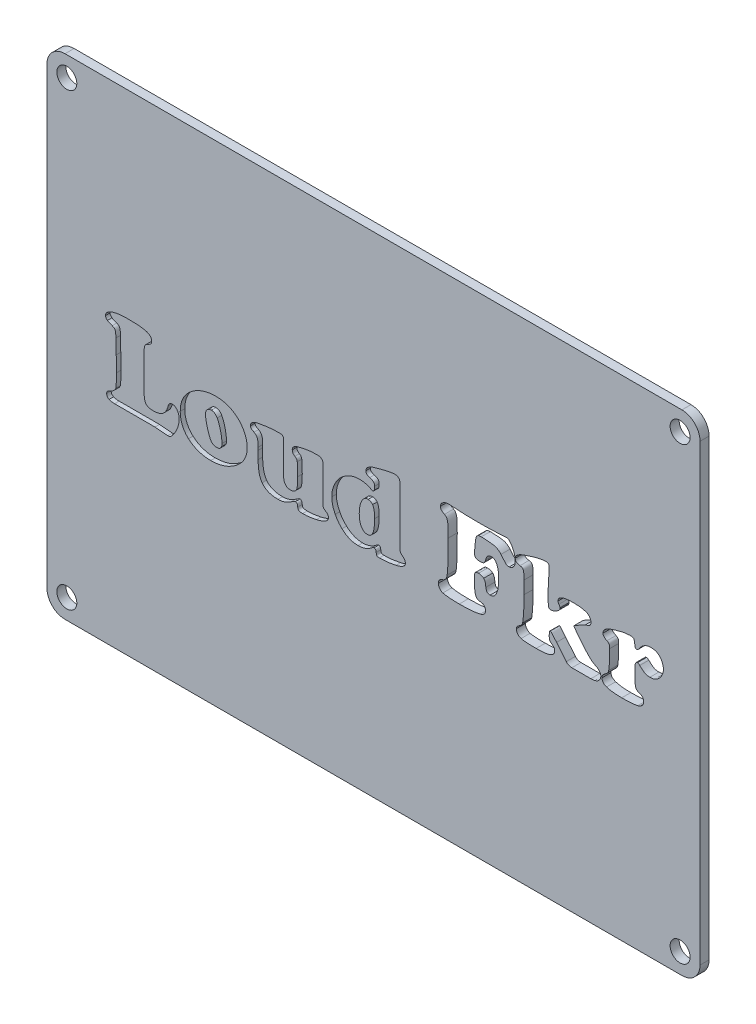
from build123d import *

# Parameters (mm, degrees)
SKETCH1_W           = 91.44
SKETCH1_H           = 68.58
SKETCH1_R           = 1.397
BOSS_EXTRUDE1_DEPTH = 1.27
FILLET1_R           = 2.54
CUT_EXTRUDE1_DEPTH  = 0.635
CUT_EXTRUDE2_DEPTH  = 115.301764016


with BuildPart() as part:
    # Sketch1 → Boss-Extrude1 (new body)
    with BuildSketch(Plane.XY):
        with Locations((45.72, -34.29)):
            Rectangle(SKETCH1_W, SKETCH1_H)
        with Locations((2.794, -2.794)):
            Circle(SKETCH1_R, mode=Mode.SUBTRACT)
        with Locations((88.646, -2.794)):
            Circle(SKETCH1_R, mode=Mode.SUBTRACT)
        with Locations((88.646, -65.786)):
            Circle(SKETCH1_R, mode=Mode.SUBTRACT)
        with Locations((2.794, -65.786)):
            Circle(SKETCH1_R, mode=Mode.SUBTRACT)
    extrude(amount=BOSS_EXTRUDE1_DEPTH)

    # Fillet1
    fillet1_edges = [part.edges().sort_by_distance(p)[0] for p in [
        (0, 0, 0.635),
        (91.44, 0, 0.635),
        (91.44, -68.58, 0.635),
        (0, -68.58, 0.635),
    ]]
    fillet(fillet1_edges, radius=FILLET1_R)

    # Sketch2 → Cut-Extrude1 (cut)
    # profile 1 of 7: a face of its own
    with BuildSketch(Plane.XY.offset(1.27)):
        with BuildLine():
            Line((13.593665071, -31.409400467), (13.593665071, -35.092058564))
            add(Edge.make_bspline(
                [(13.593665071, -35.092058564), (13.593877983, -35.191361849), (13.594283318, -35.380412688), (13.603995178, -35.650382973), (13.619759302, -35.892482346), (13.644465996, -36.107067963), (13.671425405, -36.29438211), (13.707444101, -36.454166783), (13.74835896, -36.587015108), (13.785798751, -36.662684535), (13.802661323, -36.69676542)],
                knots=[0, 0, 0, 0, 1.461508799, 2.782379926, 3.975619256, 5.03117187, 5.961293896, 6.759005249, 7.441066224, 8, 8, 8, 8], degree=3))
            add(Edge.make_bspline(
                [(13.802661323, -36.69676542), (13.825456179, -36.730615815), (13.871737525, -36.799343683), (13.965763149, -36.885192517), (14.074324987, -36.960629104), (14.201071896, -37.020663874), (14.345146215, -37.065687435), (14.506000653, -37.099190246), (14.685466341, -37.117647929), (14.810767083, -37.120479783), (14.876469653, -37.121964691)],
                knots=[0, 0, 0, 0, 0.808961849, 1.642468981, 2.512588558, 3.431324986, 4.418314909, 5.508220389, 6.693412961, 8, 8, 8, 8], degree=3))
            add(Edge.make_bspline(
                [(14.876469653, -37.121964691), (15.015329117, -37.117915811), (15.280852643, -37.110173645), (15.656374033, -37.036813833), (15.98539855, -36.910209815), (16.272800609, -36.735717501), (16.511760445, -36.500012585), (16.711512801, -36.212653721), (16.87026719, -35.869904314), (16.93973158, -35.61780364), (16.976041197, -35.486028511)],
                knots=[0, 0, 0, 0, 1.138967942, 2.177905468, 3.122632242, 4.019986689, 4.917076319, 5.856138787, 6.879385826, 8, 8, 8, 8], degree=3))
            add(Edge.make_bspline(
                [(16.976041197, -35.486028511), (16.987035698, -35.445636593), (17.008124418, -35.368160234), (17.054326896, -35.262967991), (17.106154673, -35.170814667), (17.173045839, -35.098042435), (17.247817462, -35.03877301), (17.333927625, -34.997514561), (17.429478601, -34.972719053), (17.496373985, -34.970625825), (17.530962281, -34.96954352)],
                knots=[0, 0, 0, 0, 1.210411266, 2.321708419, 3.319839119, 4.255697741, 5.164745369, 6.066965767, 7.000523566, 8, 8, 8, 8], degree=3))
            add(Edge.make_bspline(
                [(17.530962281, -34.96954352), (17.600523377, -34.973874106), (17.737227938, -34.982384765), (17.930897896, -35.059340153), (18.103107342, -35.182983803), (18.248493641, -35.354348635), (18.367333759, -35.560452166), (18.455165637, -35.798128185), (18.504705415, -36.065322506), (18.510474526, -36.252940253), (18.513484891, -36.350840589)],
                knots=[0, 0, 0, 0, 0.88104394, 1.73146674, 2.60685081, 3.551698058, 4.56400595, 5.616879257, 6.756469871, 8, 8, 8, 8], degree=3))
            add(Edge.make_bspline(
                [(18.513484891, -36.350840589), (18.51083314, -36.435001296), (18.50545918, -36.605558869), (18.471861523, -36.864114241), (18.409321967, -37.124872555), (18.331046079, -37.392507892), (18.223870061, -37.662041436), (18.096773269, -37.936998145), (17.943876112, -38.214769672), (17.828238759, -38.397369568), (17.768785602, -38.491250481)],
                knots=[0, 0, 0, 0, 0.879134621, 1.781627929, 2.716890288, 3.677352269, 4.691512925, 5.74292145, 6.839557972, 8, 8, 8, 8], degree=3))
            add(Edge.make_bspline(
                [(17.768785602, -38.491250481), (17.731917247, -38.54782676), (17.663562428, -38.652720544), (17.556909281, -38.791859767), (17.456972473, -38.901594153), (17.36377903, -38.989090671), (17.265431704, -39.049487341), (17.160903427, -39.089199636), (17.048083702, -39.118475255), (16.969040586, -39.119901099), (16.927996082, -39.120641493)],
                knots=[0, 0, 0, 0, 1.466287545, 2.718532436, 3.801787558, 4.688538304, 5.484906859, 6.289022924, 7.111545601, 8, 8, 8, 8], degree=3))
            Line((16.927996082, -39.120641493), (15.133511021, -38.966897124))
            Line((15.133511021, -38.966897124), (9.481003191, -38.966897124))
            add(Edge.make_bspline(
                [(9.481003191, -38.966897124), (9.395148199, -38.9665007), (9.236569925, -38.965768485), (9.020512374, -38.936470495), (8.840502067, -38.905341582), (8.742073375, -38.858301573), (8.697867809, -38.837175312)],
                knots=[0, 0, 0, 0, 1.284360132, 2.372274548, 3.268967995, 4, 4, 4, 4], degree=3))
            add(Edge.make_bspline(
                [(8.697867809, -38.837175312), (8.647718676, -38.804434908), (8.551568769, -38.741662402), (8.443770578, -38.608277614), (8.37768533, -38.45046452), (8.37022749, -38.336567656), (8.366356513, -38.277449717)],
                knots=[0, 0, 0, 0, 1.046618319, 2.006659878, 2.965360812, 4, 4, 4, 4], degree=3))
            add(Edge.make_bspline(
                [(8.366356513, -38.277449717), (8.367507637, -38.242070979), (8.36967805, -38.175365338), (8.391537858, -38.083561942), (8.425211465, -38.004458783), (8.480890051, -37.936647051), (8.56708185, -37.874604332), (8.68374586, -37.800888587), (8.842461416, -37.716979736), (8.962652662, -37.660304814), (9.029379106, -37.628840659)],
                knots=[0, 0, 0, 0, 0.84987494, 1.6024159, 2.257899606, 2.901952902, 3.684491105, 4.801853563, 6.224488508, 8, 8, 8, 8], degree=3))
            add(Edge.make_bspline(
                [(9.029379106, -37.628840659), (9.104204186, -37.591831465), (9.2465697, -37.521416134), (9.421304319, -37.372378444), (9.562145382, -37.207606117), (9.615466688, -37.078164156), (9.641954327, -37.013863182)],
                knots=[0, 0, 0, 0, 1.118441329, 2.127996011, 3.070072172, 4, 4, 4, 4], degree=3))
            add(Edge.make_bspline(
                [(9.641954327, -37.013863182), (9.651443176, -36.979578117), (9.673691342, -36.899191154), (9.69279993, -36.755639243), (9.708000579, -36.572774711), (9.725974636, -36.350275399), (9.737024735, -36.088286325), (9.743468274, -35.787137871), (9.748376593, -35.446005421), (9.749475417, -35.204966479), (9.750055837, -35.07764503)],
                knots=[0, 0, 0, 0, 0.439006894, 1.02932375, 1.784218129, 2.706678948, 3.785926733, 5.022652133, 6.427307048, 8, 8, 8, 8], degree=3))
            add(Edge.make_bspline(
                [(9.750055837, -35.07764503), (9.750250366, -35.011982235), (9.750660789, -34.873445355), (9.747221718, -34.655652482), (9.745720087, -34.41780882), (9.740644475, -34.159959125), (9.732854869, -33.881331572), (9.725714444, -33.581847908), (9.719191397, -33.262310829), (9.712606375, -33.042929689), (9.709217489, -32.93002837)],
                knots=[0, 0, 0, 0, 0.733621093, 1.547810731, 2.433569186, 3.391022458, 4.429174915, 5.547821784, 6.738022077, 8, 8, 8, 8], degree=3))
            add(Edge.make_bspline(
                [(9.709217489, -32.93002837), (9.705834001, -32.82113088), (9.699291417, -32.610557951), (9.692746296, -32.305433223), (9.685622866, -32.021164102), (9.677580132, -31.757756048), (9.673493386, -31.515092886), (9.668770012, -31.293283249), (9.663161683, -31.092325306), (9.661809928, -30.964986199), (9.661172373, -30.904926755)],
                knots=[0, 0, 0, 0, 1.290811243, 2.496016241, 3.615862458, 4.659837721, 5.618228382, 6.491253006, 7.288400011, 8, 8, 8, 8], degree=3))
            add(Edge.make_bspline(
                [(9.661172373, -30.904926755), (9.659371796, -30.805641632), (9.656072565, -30.623719749), (9.643287408, -30.37509935), (9.609889251, -30.178138325), (9.567926378, -30.0234457), (9.502778542, -29.901013712), (9.406124695, -29.80649708), (9.286856652, -29.724247762), (9.192204105, -29.690413472), (9.142285127, -29.672569544)],
                knots=[0, 0, 0, 0, 1.636722435, 2.998995417, 4.096684468, 4.923275682, 5.632035673, 6.350555298, 7.130096364, 8, 8, 8, 8], degree=3))
            add(Edge.make_bspline(
                [(9.142285127, -29.672569544), (9.061995326, -29.643492786), (8.91654101, -29.590816857), (8.723420234, -29.512537743), (8.57811522, -29.442777361), (8.501347662, -29.392885755), (8.469653511, -29.372287573)],
                knots=[0, 0, 0, 0, 1.387375428, 2.513391995, 3.386241001, 4, 4, 4, 4], degree=3))
            add(Edge.make_bspline(
                [(8.469653511, -29.372287573), (8.430467879, -29.338545769), (8.356825158, -29.275133794), (8.274143143, -29.160664951), (8.223126453, -29.038424058), (8.216086396, -28.953141319), (8.212612143, -28.911054465)],
                knots=[0, 0, 0, 0, 1.132906348, 2.129104565, 3.07671698, 4, 4, 4, 4], degree=3))
            add(Edge.make_bspline(
                [(8.212612143, -28.911054465), (8.215066021, -28.862607096), (8.219926414, -28.766647426), (8.26893955, -28.629181626), (8.345569562, -28.50105219), (8.45361027, -28.382494005), (8.592617417, -28.274816238), (8.760709612, -28.17719749), (8.956284049, -28.084657217), (9.100052201, -28.035924268), (9.175916708, -28.01020855)],
                knots=[0, 0, 0, 0, 0.820195922, 1.624561514, 2.448021798, 3.343799772, 4.331615032, 5.423347003, 6.640335116, 8, 8, 8, 8], degree=3))
            add(Edge.make_bspline(
                [(9.175916708, -28.01020855), (9.246988847, -27.988692405), (9.393729785, -27.944268535), (9.625375359, -27.889139774), (9.874057658, -27.844240973), (10.14028418, -27.808608405), (10.423916216, -27.780113588), (10.725079796, -27.758223729), (11.043982809, -27.746802164), (11.261867612, -27.744660274), (11.373980738, -27.74355816)],
                knots=[0, 0, 0, 0, 0.8017167, 1.655285218, 2.569419702, 3.529352722, 4.554918797, 5.647171403, 6.789346634, 8, 8, 8, 8], degree=3))
            add(Edge.make_bspline(
                [(11.373980738, -27.74355816), (11.498903889, -27.74394905), (11.739963969, -27.744703339), (12.089907853, -27.752446975), (12.415212682, -27.76269752), (12.716118886, -27.783934106), (12.992831773, -27.802946862), (13.243974621, -27.833618342), (13.472144426, -27.862406407), (13.614613565, -27.890915177), (13.682548535, -27.904509296)],
                knots=[0, 0, 0, 0, 1.293552969, 2.496126474, 3.62457801, 4.663178033, 5.619654866, 6.495965016, 7.282816113, 8, 8, 8, 8], degree=3))
            add(Edge.make_bspline(
                [(13.682548535, -27.904509296), (13.759826483, -27.923032963), (13.90685406, -27.958275746), (14.109305471, -28.031350513), (14.2798819, -28.121475236), (14.422456965, -28.221482093), (14.533149278, -28.338333064), (14.611981346, -28.469410235), (14.66355628, -28.61424002), (14.667736663, -28.716829155), (14.669875657, -28.769321374)],
                knots=[0, 0, 0, 0, 1.334238786, 2.53849775, 3.603408179, 4.566544928, 5.451472524, 6.284162535, 7.122050143, 8, 8, 8, 8], degree=3))
            add(Edge.make_bspline(
                [(14.669875657, -28.769321374), (14.668644876, -28.811049992), (14.666329706, -28.889543924), (14.64556848, -28.99868591), (14.608821484, -29.090876168), (14.55493567, -29.172215351), (14.468908126, -29.245206295), (14.348695133, -29.323688861), (14.187462058, -29.413808294), (14.064787191, -29.475338461), (13.997244041, -29.509216152)],
                knots=[0, 0, 0, 0, 0.928043933, 1.745704065, 2.457061373, 3.124202395, 3.893657096, 4.946240098, 6.318640427, 8, 8, 8, 8], degree=3))
            add(Edge.make_bspline(
                [(13.997244041, -29.509216152), (13.955805591, -29.533741656), (13.873744949, -29.58230956), (13.774282722, -29.689860077), (13.70598364, -29.82352971), (13.66524747, -29.95157616), (13.644327255, -30.074930723), (13.630730494, -30.19364029), (13.618732507, -30.337044937), (13.609612504, -30.504473726), (13.60234449, -30.696683139), (13.598673188, -30.912936491), (13.592206117, -31.153128679), (13.593163587, -31.321312545), (13.593665071, -31.409400467)],
                knots=[0, 0, 0, 0, 0.850330191, 1.683910538, 2.553914974, 3.492107334, 4.054514306, 4.769299412, 5.609739628, 6.604931469, 7.741239315, 9.019003132, 10.438674133, 12, 12, 12, 12], degree=3))
        make_face()
    # profile 2 of 7: a face of its own
    with BuildSketch(Plane.XY.offset(1.27)):
        with BuildLine():
            add(Edge.make_bspline(
                [(23.683139311, -30.972189916), (23.804162268, -30.974329484), (24.042752319, -30.978547521), (24.394810277, -31.017050694), (24.736078014, -31.071764433), (25.064432725, -31.158450671), (25.382925453, -31.263395747), (25.690100663, -31.392862188), (25.985859716, -31.547223234), (26.171989929, -31.668120893), (26.265564265, -31.728900484)],
                knots=[0, 0, 0, 0, 1.062641233, 2.094938286, 3.107860587, 4.09558599, 5.074229305, 6.051354949, 7.020346212, 8, 8, 8, 8], degree=3))
            add(Edge.make_bspline(
                [(26.265564265, -31.728900484), (26.394750584, -31.8225847), (26.652009385, -32.009145391), (26.990847947, -32.346762183), (27.295842404, -32.71975029), (27.461972241, -32.99663231), (27.545966592, -33.136622367)],
                knots=[0, 0, 0, 0, 0.996224687, 1.983859981, 2.980650473, 4, 4, 4, 4], degree=3))
            add(Edge.make_bspline(
                [(27.545966592, -33.136622367), (27.622940818, -33.287805611), (27.774698228, -33.585868725), (27.929080742, -34.059344772), (28.027924152, -34.541009215), (28.039725809, -34.866567978), (28.045635792, -35.029599914)],
                knots=[0, 0, 0, 0, 1.027888894, 2.026519308, 3.011728708, 4, 4, 4, 4], degree=3))
            add(Edge.make_bspline(
                [(28.045635792, -35.029599914), (28.041566835, -35.170916865), (28.033505053, -35.450906691), (27.952390495, -35.861304515), (27.828244681, -36.256539048), (27.650061159, -36.634618762), (27.422480479, -36.995936526), (27.146095628, -37.342237243), (26.817872049, -37.669812407), (26.570288525, -37.866632275), (26.443331192, -37.967558723)],
                knots=[0, 0, 0, 0, 0.974442933, 1.930653804, 2.876406244, 3.828469995, 4.806980817, 5.817883744, 6.881041618, 8, 8, 8, 8], degree=3))
            add(Edge.make_bspline(
                [(26.443331192, -37.967558723), (26.31496806, -38.059272172), (26.059840236, -38.241557008), (25.655328596, -38.477550566), (25.235330971, -38.673581713), (24.804456378, -38.839783396), (24.357386462, -38.963014347), (23.897728825, -39.055939097), (23.423310432, -39.108441135), (23.102714938, -39.116548157), (22.940842278, -39.120641493)],
                knots=[0, 0, 0, 0, 1.008320987, 2.004085863, 2.988892518, 3.969230791, 4.95309211, 5.950132858, 6.964996531, 8, 8, 8, 8], degree=3))
            add(Edge.make_bspline(
                [(22.940842278, -39.120641493), (22.784549446, -39.117564808), (22.478326709, -39.111536695), (22.030844092, -39.059890554), (21.605029095, -38.977319713), (21.203668623, -38.855911778), (20.822589677, -38.705407457), (20.467486189, -38.51619956), (20.130836273, -38.29826238), (19.928961078, -38.124526443), (19.827518798, -38.03722414)],
                knots=[0, 0, 0, 0, 1.111186007, 2.17713388, 3.199031035, 4.19176005, 5.155127904, 6.107832902, 7.049186086, 8, 8, 8, 8], degree=3))
            add(Edge.make_bspline(
                [(19.827518798, -38.03722414), (19.734870213, -37.948771139), (19.551497666, -37.773702603), (19.316531386, -37.477739301), (19.115400529, -37.164126399), (18.950598642, -36.829854955), (18.823561449, -36.475073548), (18.731680509, -36.100895636), (18.679048727, -35.706930713), (18.671221233, -35.438137607), (18.66722926, -35.301054817)],
                knots=[0, 0, 0, 0, 1.002004799, 1.983194585, 2.950279153, 3.914901104, 4.894687499, 5.895337746, 6.926635511, 8, 8, 8, 8], degree=3))
            add(Edge.make_bspline(
                [(18.66722926, -35.301054817), (18.670969891, -35.147838354), (18.67831283, -34.847071099), (18.748337369, -34.407522204), (18.857867619, -33.987994301), (19.01534663, -33.591398623), (19.213505324, -33.213558941), (19.460246699, -32.860789779), (19.750462354, -32.528100152), (19.971845515, -32.329622343), (20.084560166, -32.228569685)],
                knots=[0, 0, 0, 0, 1.049886793, 2.060950654, 3.043846813, 4.017575187, 4.980390521, 5.9627958, 6.96278127, 8, 8, 8, 8], degree=3))
            add(Edge.make_bspline(
                [(20.084560166, -32.228569685), (20.209095795, -32.127350818), (20.456654483, -31.926142458), (20.861133674, -31.6741337), (21.281110769, -31.453614129), (21.724286462, -31.280439161), (22.186069516, -31.141717123), (22.667765446, -31.04468319), (23.169007542, -30.982089607), (23.509986025, -30.975524011), (23.683139311, -30.972189916)],
                knots=[0, 0, 0, 0, 0.988185139, 1.964368086, 2.931161969, 3.90809314, 4.891794618, 5.899359696, 6.933267668, 8, 8, 8, 8], degree=3))
        make_face()
        with BuildLine():
            add(Edge.make_bspline(
                [(23.044139276, -32.970866718), (22.982853747, -32.972804652), (22.865359309, -32.976519988), (22.700121778, -33.028278244), (22.552176768, -33.104952646), (22.427622633, -33.215048195), (22.324047217, -33.347516019), (22.255685901, -33.50574129), (22.210253942, -33.681800733), (22.205719281, -33.806534631), (22.203349756, -33.871712633)],
                knots=[0, 0, 0, 0, 1.055486929, 2.023542025, 2.964995731, 3.917078518, 4.875182125, 5.847977776, 6.87549006, 8, 8, 8, 8], degree=3))
            add(Edge.make_bspline(
                [(22.203349756, -33.871712633), (22.2060879, -33.954282262), (22.212037158, -34.133684122), (22.250873223, -34.42340346), (22.315170818, -34.753763761), (22.396580977, -35.115365769), (22.493959134, -35.486219688), (22.608264389, -35.84351165), (22.726287339, -36.18126797), (22.817201532, -36.395321771), (22.861567837, -36.499780446)],
                knots=[0, 0, 0, 0, 0.727831329, 1.581384058, 2.572526043, 3.69406176, 4.847955053, 5.950677735, 6.999926712, 8, 8, 8, 8], degree=3))
            add(Edge.make_bspline(
                [(22.861567837, -36.499780446), (22.884111766, -36.549448283), (22.927443212, -36.644914304), (23.01437996, -36.770627021), (23.106431322, -36.880362845), (23.212884331, -36.968341327), (23.327826831, -37.039248437), (23.45591896, -37.087378357), (23.593706434, -37.116803733), (23.689393063, -37.12021691), (23.738391194, -37.121964691)],
                knots=[0, 0, 0, 0, 1.138986605, 2.189234081, 3.186980087, 4.12661892, 5.066257754, 5.999751663, 6.975735358, 8, 8, 8, 8], degree=3))
            add(Edge.make_bspline(
                [(23.738391194, -37.121964691), (23.798657164, -37.119114439), (23.912541435, -37.113728333), (24.073341616, -37.075815596), (24.210696711, -37.008558629), (24.322711296, -36.9113322), (24.408411249, -36.787256593), (24.468376037, -36.63632767), (24.503518634, -36.459746958), (24.507444818, -36.333394031), (24.509515296, -36.266761637)],
                knots=[0, 0, 0, 0, 1.096446384, 2.071948677, 2.984345692, 3.852126794, 4.741540793, 5.702236131, 6.788270977, 8, 8, 8, 8], degree=3))
            add(Edge.make_bspline(
                [(24.509515296, -36.266761637), (24.506977051, -36.156980227), (24.501721383, -35.929667902), (24.464269853, -35.578065455), (24.399714095, -35.205851738), (24.318581693, -34.820624335), (24.21811611, -34.443753172), (24.104748135, -34.094363833), (23.986362161, -33.780493281), (23.888247715, -33.591466554), (23.841688192, -33.501765244)],
                knots=[0, 0, 0, 0, 0.918880542, 1.90262517, 2.956057667, 4.080053818, 5.197013208, 6.218685079, 7.154689467, 8, 8, 8, 8], degree=3))
            add(Edge.make_bspline(
                [(23.841688192, -33.501765244), (23.793185333, -33.423729377), (23.700802337, -33.275095105), (23.510611403, -33.102963995), (23.287205401, -32.994469682), (23.126190257, -32.978834288), (23.044139276, -32.970866718)],
                knots=[0, 0, 0, 0, 1.0927213, 2.081297263, 3.022256926, 4, 4, 4, 4], degree=3))
        make_face(mode=Mode.SUBTRACT)
    # profile 3 of 7: a face of its own
    with BuildSketch(Plane.XY.offset(1.27)):
        with BuildLine():
            Line((33.119199981, -31.37336663), (33.119199981, -35.723851832))
            add(Edge.make_bspline(
                [(33.119199981, -35.723851832), (33.121116796, -35.832984277), (33.124732694, -36.03885277), (33.173259202, -36.325430177), (33.247021148, -36.57057735), (33.356893449, -36.771875797), (33.498585746, -36.930190415), (33.673069333, -37.045870825), (33.881128743, -37.11087383), (34.029205537, -37.118160037), (34.106527103, -37.121964691)],
                knots=[0, 0, 0, 0, 1.345773111, 2.538679328, 3.576638577, 4.492661081, 5.346508194, 6.174556154, 7.046804208, 8, 8, 8, 8], degree=3))
            add(Edge.make_bspline(
                [(34.106527103, -37.121964691), (34.18898871, -37.114732829), (34.358458133, -37.099870402), (34.558979881, -37.017819902), (34.702685936, -36.926174255), (34.798892067, -36.852482707), (34.875207177, -36.767859548), (34.910771879, -36.703902144), (34.928098577, -36.672742862)],
                knots=[0, 0, 0, 0, 1.517933122, 3.119551747, 3.921276638, 4.65579151, 5.345117707, 6, 6, 6, 6], degree=3))
            add(Edge.make_bspline(
                [(34.928098577, -36.672742862), (34.944308007, -36.637071792), (34.980483241, -36.557463237), (35.015511849, -36.417668126), (35.046643228, -36.249947495), (35.07197842, -36.053371735), (35.094036846, -35.827524748), (35.10686769, -35.572619106), (35.117444445, -35.289132051), (35.117728121, -35.090469796), (35.117876783, -34.986359311)],
                knots=[0, 0, 0, 0, 0.549895256, 1.22722327, 2.017662001, 2.949051805, 4.012102893, 5.207315713, 6.536472276, 8, 8, 8, 8], degree=3))
            add(Edge.make_bspline(
                [(35.117876783, -34.986359311), (35.118367881, -34.883058037), (35.119312071, -34.684449883), (35.11284969, -34.399410174), (35.109160409, -34.139925679), (35.101917304, -33.906882873), (35.092522795, -33.699445518), (35.080737278, -33.517626044), (35.067022362, -33.36052087), (35.054131716, -33.264706468), (35.048211366, -33.220701319)],
                knots=[0, 0, 0, 0, 1.402061571, 2.695618853, 3.869639097, 4.924406546, 5.860124755, 6.68793121, 7.39739975, 8, 8, 8, 8], degree=3))
            add(Edge.make_bspline(
                [(35.048211366, -33.220701319), (35.039180731, -33.163130608), (35.023526389, -33.063333459), (34.962104776, -32.928527253), (34.854650822, -32.820486896), (34.766065377, -32.75923106), (34.714297813, -32.723434374)],
                knots=[0, 0, 0, 0, 1.11515293, 1.933085101, 2.792136231, 4, 4, 4, 4], degree=3))
            add(Edge.make_bspline(
                [(34.714297813, -32.723434374), (34.659451397, -32.684097804), (34.554957459, -32.609153378), (34.435147613, -32.46434226), (34.363702331, -32.299412607), (34.354026347, -32.183586016), (34.349154936, -32.125272687)],
                knots=[0, 0, 0, 0, 1.103877318, 2.103118077, 3.045007714, 4, 4, 4, 4], degree=3))
            add(Edge.make_bspline(
                [(34.349154936, -32.125272687), (34.351325819, -32.081759398), (34.355586345, -31.996361192), (34.3932161, -31.874702901), (34.45281354, -31.763101684), (34.535363741, -31.661395), (34.643333949, -31.571539032), (34.775744678, -31.496534884), (34.927316197, -31.424712481), (35.039626642, -31.391056651), (35.098658737, -31.37336663)],
                knots=[0, 0, 0, 0, 0.90777164, 1.781572266, 2.635260458, 3.539785352, 4.502094978, 5.552791294, 6.713709538, 8, 8, 8, 8], degree=3))
            add(Edge.make_bspline(
                [(35.098658737, -31.37336663), (35.33491027, -31.31141809), (35.802526949, -31.188802291), (36.510465664, -31.067681553), (37.212263088, -30.984732196), (37.67924395, -30.976358314), (37.911700245, -30.972189916)],
                knots=[0, 0, 0, 0, 1.027914597, 2.034568848, 3.021636903, 4, 4, 4, 4], degree=3))
            add(Edge.make_bspline(
                [(37.911700245, -30.972189916), (37.97198356, -30.974894959), (38.086873257, -30.980050309), (38.2476749, -31.020147819), (38.384523729, -31.089419081), (38.499193014, -31.184509071), (38.5845816, -31.312616854), (38.643205503, -31.466133102), (38.679723425, -31.645545911), (38.683312623, -31.773547974), (38.685226603, -31.841806506)],
                knots=[0, 0, 0, 0, 1.085074017, 2.067965667, 2.958023595, 3.827753568, 4.7197955, 5.697276404, 6.772046872, 8, 8, 8, 8], degree=3))
            add(Edge.make_bspline(
                [(38.685226603, -31.841806506), (38.685355226, -31.86022582), (38.685668479, -31.905084977), (38.682176123, -31.984326012), (38.680286614, -32.087634359), (38.678826118, -32.1645096), (38.678019836, -32.206949383)],
                knots=[0, 0, 0, 0, 0.605119014, 1.47373179, 2.605347134, 4, 4, 4, 4], degree=3))
            add(Edge.make_bspline(
                [(38.678019836, -32.206949383), (38.675605407, -32.275012491), (38.670492832, -32.419136693), (38.662713229, -32.645718619), (38.658762258, -32.894795981), (38.655633866, -33.067758843), (38.653997278, -33.158242668)],
                knots=[0, 0, 0, 0, 0.858822478, 1.818563799, 2.858803039, 4, 4, 4, 4], degree=3))
            Line((38.653997278, -33.158242668), (38.653997278, -36.742408279))
            add(Edge.make_bspline(
                [(38.653997278, -36.742408279), (38.659660019, -36.788261826), (38.671551009, -36.884548067), (38.758211889, -37.018840192), (38.892831773, -37.142502253), (39.007048237, -37.208398311), (39.069587527, -37.244479736)],
                knots=[0, 0, 0, 0, 0.803790862, 1.687851993, 2.733982043, 4, 4, 4, 4], degree=3))
            add(Edge.make_bspline(
                [(39.069587527, -37.244479736), (39.123104733, -37.277775275), (39.225668215, -37.341584782), (39.339366531, -37.479352575), (39.412232743, -37.639043863), (39.419164123, -37.754565185), (39.422719125, -37.813814353)],
                knots=[0, 0, 0, 0, 1.066814983, 2.044506211, 2.997056313, 4, 4, 4, 4], degree=3))
            add(Edge.make_bspline(
                [(39.422719125, -37.813814353), (39.417684376, -37.871670786), (39.407478706, -37.988948443), (39.318186612, -38.154106799), (39.182647785, -38.306902666), (38.991269385, -38.446274728), (38.749131325, -38.573465339), (38.455342092, -38.693335715), (38.109489185, -38.802269979), (37.85926842, -38.862778241), (37.726726551, -38.894829451)],
                knots=[0, 0, 0, 0, 0.644606569, 1.306647239, 2.056970726, 2.921866342, 3.941513106, 5.116150452, 6.472425696, 8, 8, 8, 8], degree=3))
            add(Edge.make_bspline(
                [(37.726726551, -38.894829451), (37.562929804, -38.929658396), (37.239244946, -38.998485174), (36.752796473, -39.065869965), (36.275061542, -39.112254418), (35.958773481, -39.117868168), (35.802519678, -39.120641493)],
                knots=[0, 0, 0, 0, 1.034903954, 2.045112292, 3.034239112, 4, 4, 4, 4], degree=3))
            add(Edge.make_bspline(
                [(35.802519678, -39.120641493), (35.744033428, -39.120042391), (35.636372825, -39.118939574), (35.489522932, -39.103490496), (35.372958678, -39.0757104), (35.281320841, -39.037591595), (35.212878428, -38.97710036), (35.166826868, -38.895566043), (35.131540302, -38.795604008), (35.122693071, -38.72141563), (35.117876783, -38.681028687)],
                knots=[0, 0, 0, 0, 1.502989962, 2.766681168, 3.784981757, 4.577023038, 5.29145983, 6.085637436, 6.957852242, 8, 8, 8, 8], degree=3))
            add(Edge.make_bspline(
                [(35.117876783, -38.681028687), (35.113467401, -38.641748985), (35.105151342, -38.567667787), (35.087383045, -38.463285041), (35.059483472, -38.374929203), (35.022935286, -38.302459684), (34.979207369, -38.246702409), (34.930328729, -38.202511805), (34.870142821, -38.177526169), (34.82741569, -38.175293526), (34.805583533, -38.174152719)],
                knots=[0, 0, 0, 0, 1.445182662, 2.725602704, 3.864316133, 4.820130558, 5.67513721, 6.443567701, 7.204714326, 8, 8, 8, 8], degree=3))
            add(Edge.make_bspline(
                [(34.805583533, -38.174152719), (34.774036439, -38.176536849), (34.711498099, -38.181263101), (34.629679249, -38.214413806), (34.549104774, -38.267462009), (34.444518389, -38.334801685), (34.298731222, -38.433266557), (34.188088312, -38.510302336), (34.125745149, -38.553709131)],
                knots=[0, 0, 0, 0, 0.71891691, 1.425166756, 1.983356574, 2.921565119, 4.265416507, 6, 6, 6, 6], degree=3))
            add(Edge.make_bspline(
                [(34.125745149, -38.553709131), (34.05672033, -38.598820416), (33.919883448, -38.688250388), (33.70550972, -38.802297429), (33.48903607, -38.902791055), (33.267336945, -38.980831544), (33.043093016, -39.04505296), (32.813749921, -39.087193821), (32.580958107, -39.114657771), (32.424224553, -39.118643797), (32.345673623, -39.120641493)],
                knots=[0, 0, 0, 0, 1.042770416, 2.067219493, 3.069179406, 4.059392366, 5.037717334, 6.017300464, 7.006320676, 8, 8, 8, 8], degree=3))
            add(Edge.make_bspline(
                [(32.345673623, -39.120641493), (32.219058266, -39.117815289), (31.975533663, -39.112379532), (31.623602785, -39.072621098), (31.301166711, -39.000187125), (31.006442458, -38.90298718), (30.740509302, -38.776860614), (30.503344161, -38.623270945), (30.294832881, -38.438458364), (30.180827683, -38.294485094), (30.123587034, -38.222197835)],
                knots=[0, 0, 0, 0, 1.219844127, 2.346177146, 3.405575075, 4.398531192, 5.330255769, 6.233270051, 7.112945992, 8, 8, 8, 8], degree=3))
            add(Edge.make_bspline(
                [(30.123587034, -38.222197835), (30.079612349, -38.155031275), (29.987923667, -38.014986765), (29.8755552, -37.77707158), (29.783489161, -37.506631539), (29.707088404, -37.20527825), (29.647832525, -36.872082849), (29.604785713, -36.507163124), (29.582270839, -36.110096651), (29.578057546, -35.835181404), (29.575872718, -35.692622507)],
                knots=[0, 0, 0, 0, 0.733079512, 1.52849517, 2.396423576, 3.34071949, 4.367092384, 5.487256463, 6.697002252, 8, 8, 8, 8], degree=3))
            add(Edge.make_bspline(
                [(29.575872718, -35.692622507), (29.575635791, -35.586121555), (29.575179744, -35.381123985), (29.578318299, -35.085652266), (29.580522861, -34.814196375), (29.58225399, -34.641235054), (29.583079486, -34.558757783)],
                knots=[0, 0, 0, 0, 1.12708678, 2.169464641, 3.127102184, 4, 4, 4, 4], degree=3))
            add(Edge.make_bspline(
                [(29.583079486, -34.558757783), (29.583079486, -34.517118683), (29.583079486, -34.440246498), (29.583079486, -34.336148748), (29.583079486, -34.2536713), (29.583079486, -34.206426937), (29.583079486, -34.186408139)],
                knots=[0, 0, 0, 0, 1.341935484, 2.477419355, 3.35483871, 4, 4, 4, 4], degree=3))
            add(Edge.make_bspline(
                [(29.583079486, -34.186408139), (29.582062152, -34.078262835), (29.580167639, -33.876871046), (29.557544058, -33.598030998), (29.517594005, -33.364639207), (29.462921047, -33.170941518), (29.387190399, -33.006224746), (29.280256458, -32.868806385), (29.152417307, -32.744992579), (29.049604347, -32.683084654), (28.996929077, -32.651366701)],
                knots=[0, 0, 0, 0, 1.49392735, 2.782041299, 3.8606516, 4.760330974, 5.557049213, 6.346978869, 7.153089902, 8, 8, 8, 8], degree=3))
            add(Edge.make_bspline(
                [(28.996929077, -32.651366701), (28.948657859, -32.626165456), (28.859967614, -32.579862406), (28.7432574, -32.511531789), (28.654751419, -32.45177022), (28.574747521, -32.382930932), (28.516644064, -32.271603746), (28.510289433, -32.176476972), (28.5068689, -32.125272687)],
                knots=[0, 0, 0, 0, 1.276777893, 2.345864642, 3.168808341, 3.780115348, 4.805093419, 6, 6, 6, 6], degree=3))
            add(Edge.make_bspline(
                [(28.5068689, -32.125272687), (28.509442328, -32.076090331), (28.514445434, -31.980472884), (28.559706404, -31.843349378), (28.636764065, -31.721224024), (28.7418637, -31.612476149), (28.875585515, -31.517274429), (29.0388762, -31.436457358), (29.231038608, -31.367686586), (29.370505986, -31.333608784), (29.443748651, -31.315712492)],
                knots=[0, 0, 0, 0, 0.873782752, 1.698757099, 2.537412736, 3.424696794, 4.374268104, 5.445330677, 6.65839029, 8, 8, 8, 8], degree=3))
            add(Edge.make_bspline(
                [(29.443748651, -31.315712492), (29.709849708, -31.262004551), (30.23890791, -31.155223214), (31.040031467, -31.053334388), (31.839185388, -30.984487892), (32.372753825, -30.976281149), (32.638748827, -30.972189916)],
                knots=[0, 0, 0, 0, 1.01164416, 2.011336015, 3.008609499, 4, 4, 4, 4], degree=3))
            add(Edge.make_bspline(
                [(32.638748827, -30.972189916), (32.676425793, -30.973903639), (32.747377771, -30.977130863), (32.846825917, -30.992014402), (32.931665846, -31.02337099), (32.999434088, -31.070126857), (33.05549797, -31.126920463), (33.094170432, -31.19834359), (33.115560462, -31.282459737), (33.117944613, -31.342010391), (33.119199981, -31.37336663)],
                knots=[0, 0, 0, 0, 1.263624936, 2.379615359, 3.356279755, 4.264184236, 5.118153302, 6.006823734, 6.950498335, 8, 8, 8, 8], degree=3))
        make_face()
    # profile 4 of 7: a face of its own
    with BuildSketch(Plane.XY.offset(1.27)):
        with BuildLine():
            Line((49.416103134, -28.569934145), (49.416103134, -36.057765385))
            add(Edge.make_bspline(
                [(49.416103134, -36.057765385), (49.416157528, -36.154660696), (49.416255563, -36.329295774), (49.426136183, -36.563325042), (49.438459865, -36.739753253), (49.457590057, -36.870530396), (49.499189896, -36.969677116), (49.555549241, -37.06062147), (49.635730022, -37.148441934), (49.699690322, -37.202003705), (49.733200896, -37.230066201)],
                knots=[0, 0, 0, 0, 1.827235339, 3.293238694, 4.414350405, 5.166657527, 5.76954803, 6.427421524, 7.176082548, 8, 8, 8, 8], degree=3))
            add(Edge.make_bspline(
                [(49.733200896, -37.230066201), (49.774513735, -37.262317859), (49.852011643, -37.322818083), (49.952944198, -37.415571171), (50.031610722, -37.503478622), (50.110575195, -37.612172935), (50.172567578, -37.767844111), (50.18060837, -37.898855838), (50.184824981, -37.967558723)],
                knots=[0, 0, 0, 0, 1.044922428, 1.960148549, 2.729287334, 3.393848048, 4.633327253, 6, 6, 6, 6], degree=3))
            add(Edge.make_bspline(
                [(50.184824981, -37.967558723), (50.181536769, -38.015562471), (50.174888774, -38.112614814), (50.105375781, -38.248511325), (50.000625325, -38.373609859), (49.85553286, -38.488977923), (49.669704526, -38.593315751), (49.445173809, -38.691252632), (49.179689136, -38.779578005), (48.987298213, -38.82662371), (48.885204609, -38.851588847)],
                knots=[0, 0, 0, 0, 0.681204303, 1.37723566, 2.13313051, 3.003334248, 4.008072122, 5.170910679, 6.498723749, 8, 8, 8, 8], degree=3))
            add(Edge.make_bspline(
                [(48.885204609, -38.851588847), (48.690247198, -38.893173208), (48.302192077, -38.975945258), (47.715512092, -39.057831578), (47.129348851, -39.111087882), (46.738505075, -39.117456109), (46.543005232, -39.120641493)],
                knots=[0, 0, 0, 0, 1.01231553, 2.014974569, 3.007091363, 4, 4, 4, 4], degree=3))
            add(Edge.make_bspline(
                [(46.543005232, -39.120641493), (46.503727899, -39.119878972), (46.432055708, -39.118487545), (46.335603851, -39.105261908), (46.260802094, -39.082312091), (46.202520453, -39.046454378), (46.165022026, -38.986747876), (46.141142803, -38.905520455), (46.115736365, -38.80079031), (46.109325657, -38.720466183), (46.105794681, -38.676224175)],
                knots=[0, 0, 0, 0, 1.276841484, 2.329945074, 3.153285508, 3.810412278, 4.503682524, 5.384695261, 6.559507144, 8, 8, 8, 8], degree=3))
            add(Edge.make_bspline(
                [(46.105794681, -38.676224175), (46.097523388, -38.615440516), (46.082800939, -38.507248925), (46.025245252, -38.370601785), (45.932705075, -38.277082208), (45.854546628, -38.267745719), (45.815121733, -38.263036183)],
                knots=[0, 0, 0, 0, 1.31830616, 2.346512896, 3.165943556, 4, 4, 4, 4], degree=3))
            add(Edge.make_bspline(
                [(45.815121733, -38.263036183), (45.789144313, -38.266622143), (45.727111439, -38.275185249), (45.62957953, -38.326415871), (45.514517772, -38.404595244), (45.434261929, -38.469696887), (45.389922461, -38.505664016)],
                knots=[0, 0, 0, 0, 0.630189778, 1.504863927, 2.621495956, 4, 4, 4, 4], degree=3))
            add(Edge.make_bspline(
                [(45.389922461, -38.505664016), (45.320997154, -38.554832647), (45.184846038, -38.651957554), (44.96991397, -38.77658923), (44.750255429, -38.883523613), (44.523566045, -38.970257593), (44.291160347, -39.037037738), (44.05348848, -39.085634829), (43.8099933, -39.115257934), (43.645166806, -39.118833268), (43.561805819, -39.120641493)],
                knots=[0, 0, 0, 0, 1.034507892, 2.043507813, 3.032945298, 4.01825839, 5.006533084, 5.985602546, 6.981218644, 8, 8, 8, 8], degree=3))
            add(Edge.make_bspline(
                [(43.561805819, -39.120641493), (43.459159503, -39.117908291), (43.255349761, -39.112481372), (42.953552608, -39.067780001), (42.660280661, -38.995387894), (42.373135657, -38.896653929), (42.095807532, -38.765821106), (41.824167848, -38.609765679), (41.564240021, -38.420025621), (41.39959252, -38.277835018), (41.315696673, -38.205382044)],
                knots=[0, 0, 0, 0, 0.991355841, 1.968389943, 2.940356964, 3.906796927, 4.89670271, 5.898538577, 6.929203993, 8, 8, 8, 8], degree=3))
            add(Edge.make_bspline(
                [(41.315696673, -38.205382044), (41.221014284, -38.111744671), (41.032006733, -37.924823212), (40.781248596, -37.615508431), (40.554186938, -37.288390718), (40.429433613, -37.054438424), (40.366805643, -36.936990997)],
                knots=[0, 0, 0, 0, 1.003239613, 2.00269409, 2.997323611, 4, 4, 4, 4], degree=3))
            add(Edge.make_bspline(
                [(40.366805643, -36.936990997), (40.292512694, -36.783226782), (40.14642024, -36.48085904), (39.996057717, -36.006680534), (39.903305719, -35.529703635), (39.890381598, -35.210175776), (39.883952233, -35.051220216)],
                knots=[0, 0, 0, 0, 1.041980448, 2.0489896, 3.029430639, 4, 4, 4, 4], degree=3))
            add(Edge.make_bspline(
                [(39.883952233, -35.051220216), (39.88588189, -34.958271115), (39.88975035, -34.771932393), (39.918546925, -34.493883112), (39.970125381, -34.218017957), (40.039938645, -33.945450576), (40.126003503, -33.674249172), (40.234842331, -33.407033962), (40.364966615, -33.143066059), (40.463569811, -32.971160762), (40.513343246, -32.884385511)],
                knots=[0, 0, 0, 0, 0.976289265, 1.957205519, 2.932225769, 3.921652062, 4.911185609, 5.91864579, 6.949363188, 8, 8, 8, 8], degree=3))
            add(Edge.make_bspline(
                [(40.513343246, -32.884385511), (40.562680758, -32.805956301), (40.661072841, -32.649547656), (40.827615708, -32.429668865), (41.005194832, -32.221303489), (41.198158549, -32.030626118), (41.400443349, -31.849569942), (41.620413226, -31.688217014), (41.85007036, -31.535112667), (42.012439232, -31.446646722), (42.094027543, -31.4021937)],
                knots=[0, 0, 0, 0, 1.012811409, 2.019814559, 3.013287412, 4.003977856, 4.984242146, 5.978987669, 6.984466788, 8, 8, 8, 8], degree=3))
            add(Edge.make_bspline(
                [(42.094027543, -31.4021937), (42.232018687, -31.336427274), (42.501600028, -31.207945107), (42.920619472, -31.074691022), (43.335556501, -30.98731599), (43.612635297, -30.977183354), (43.74918177, -30.972189916)],
                knots=[0, 0, 0, 0, 1.06199812, 2.074733715, 3.051214591, 4, 4, 4, 4], degree=3))
            add(Edge.make_bspline(
                [(43.74918177, -30.972189916), (43.90170955, -30.977003614), (44.20090008, -30.986445912), (44.635967111, -31.068443946), (45.048696138, -31.19875717), (45.301842518, -31.329596705), (45.428358554, -31.394986932)],
                knots=[0, 0, 0, 0, 1.044833356, 2.049490555, 3.02518566, 4, 4, 4, 4], degree=3))
            add(Edge.make_bspline(
                [(45.428358554, -31.394986932), (45.463626181, -31.413434589), (45.525159058, -31.445620973), (45.593689233, -31.4555918), (45.622941271, -31.459847838)],
                knots=[0, 0, 0, 0, 1.146301936, 2, 2, 2, 2], degree=3))
            add(Edge.make_bspline(
                [(45.622941271, -31.459847838), (45.643328545, -31.457198784), (45.684150086, -31.451894571), (45.741358982, -31.41793963), (45.783189395, -31.358675891), (45.819992754, -31.281683195), (45.84732483, -31.183354915), (45.865553316, -31.063249808), (45.877100495, -30.922760642), (45.878983061, -30.821672523), (45.879982639, -30.767998176)],
                knots=[0, 0, 0, 0, 0.611936942, 1.225284421, 1.9262949, 2.752889071, 3.77826101, 4.969937732, 6.391140189, 8, 8, 8, 8], degree=3))
            add(Edge.make_bspline(
                [(45.879982639, -30.767998176), (45.878416196, -30.722153154), (45.875440128, -30.635052683), (45.845953156, -30.514085579), (45.801007847, -30.408181586), (45.72905937, -30.321473151), (45.635669959, -30.243988323), (45.514116257, -30.175749211), (45.363612023, -30.113992512), (45.252526163, -30.079979981), (45.192937488, -30.061734979)],
                knots=[0, 0, 0, 0, 1.014525416, 1.927486077, 2.745952384, 3.541765893, 4.398802355, 5.425067494, 6.618754747, 8, 8, 8, 8], degree=3))
            add(Edge.make_bspline(
                [(45.192937488, -30.061734979), (45.150158429, -30.048226828), (45.068732315, -30.022515271), (44.957579121, -29.971682176), (44.862546979, -29.915229537), (44.786524738, -29.848298713), (44.724340987, -29.775845153), (44.680842131, -29.693845762), (44.656362859, -29.604265332), (44.652172999, -29.542991939), (44.650027684, -29.511618407)],
                knots=[0, 0, 0, 0, 1.28847204, 2.452491297, 3.506620916, 4.452941209, 5.351879176, 6.23745481, 7.097532159, 8, 8, 8, 8], degree=3))
            add(Edge.make_bspline(
                [(44.650027684, -29.511618407), (44.653932553, -29.459897516), (44.661784304, -29.355899245), (44.72031096, -29.205305955), (44.81810644, -29.065849283), (44.95295121, -28.935457742), (45.125968144, -28.816297507), (45.335487824, -28.706367229), (45.580523785, -28.603148499), (45.759328411, -28.546786889), (45.853557825, -28.517084518)],
                knots=[0, 0, 0, 0, 0.743253968, 1.494504921, 2.290388897, 3.178608486, 4.179311117, 5.303208065, 6.578800068, 8, 8, 8, 8], degree=3))
            add(Edge.make_bspline(
                [(45.853557825, -28.517084518), (46.023266673, -28.468873267), (46.347881837, -28.376655899), (46.813028627, -28.247350037), (47.235978556, -28.14358126), (47.613035753, -28.052076521), (47.947362452, -27.984838769), (48.238086067, -27.936234506), (48.484944087, -27.904616222), (48.635301518, -27.899564668), (48.70263317, -27.897302529)],
                knots=[0, 0, 0, 0, 1.449067367, 2.771742586, 3.964900521, 5.025759732, 5.958311255, 6.764912991, 7.446914946, 8, 8, 8, 8], degree=3))
            add(Edge.make_bspline(
                [(48.70263317, -27.897302529), (48.758854916, -27.898662074), (48.864304579, -27.90121204), (49.011753215, -27.932511372), (49.137536541, -27.985218124), (49.240927259, -28.060653683), (49.320860259, -28.158298587), (49.376161882, -28.277141636), (49.409811063, -28.416775981), (49.413923506, -28.516878831), (49.416103134, -28.569934145)],
                knots=[0, 0, 0, 0, 1.199025485, 2.248895533, 3.198734672, 4.091435074, 4.954148129, 5.864366852, 6.86809728, 8, 8, 8, 8], degree=3))
        make_face()
        with BuildLine():
            add(Edge.make_bspline(
                [(44.96472319, -32.817122349), (44.922113235, -32.818002631), (44.838409688, -32.819731868), (44.717501442, -32.848354173), (44.603607919, -32.888997312), (44.495174045, -32.945084836), (44.394450461, -33.020276492), (44.301182232, -33.112500227), (44.213065305, -33.218924989), (44.163797146, -33.299297114), (44.138347205, -33.340814107)],
                knots=[0, 0, 0, 0, 0.991872175, 1.948446508, 2.882305768, 3.809976116, 4.785344033, 5.802757687, 6.864993376, 8, 8, 8, 8], degree=3))
            add(Edge.make_bspline(
                [(44.138347205, -33.340814107), (44.105395319, -33.401202378), (44.038588108, -33.523634584), (43.953646656, -33.72007497), (43.885576231, -33.931370716), (43.827993375, -34.15520848), (43.781309127, -34.392441556), (43.751857147, -34.643849696), (43.731861547, -34.909167628), (43.729018893, -35.090417616), (43.727561468, -35.183344284)],
                knots=[0, 0, 0, 0, 0.864477185, 1.752655737, 2.685294006, 3.652070916, 4.656875791, 5.721841767, 6.831990807, 8, 8, 8, 8], degree=3))
            add(Edge.make_bspline(
                [(43.727561468, -35.183344284), (43.729342872, -35.266638632), (43.732806485, -35.42858914), (43.748084684, -35.663865173), (43.779667542, -35.882877146), (43.822716496, -36.086031666), (43.877387435, -36.273464826), (43.944638944, -36.446056157), (44.025659658, -36.602145331), (44.090179375, -36.696539406), (44.121531414, -36.742408279)],
                knots=[0, 0, 0, 0, 1.223209389, 2.378305193, 3.459030218, 4.469015474, 5.425077601, 6.322371714, 7.18479078, 8, 8, 8, 8], degree=3))
            add(Edge.make_bspline(
                [(44.121531414, -36.742408279), (44.1701169, -36.800533982), (44.26452118, -36.913475429), (44.449841839, -37.033079752), (44.657768509, -37.109996619), (44.806258107, -37.117885247), (44.883046494, -37.121964691)],
                knots=[0, 0, 0, 0, 1.024106411, 1.989895258, 2.960515066, 4, 4, 4, 4], degree=3))
            add(Edge.make_bspline(
                [(44.883046494, -37.121964691), (44.925615209, -37.12000935), (45.008405015, -37.116206502), (45.128163191, -37.089758874), (45.237535896, -37.043297333), (45.337471689, -36.979219986), (45.430202968, -36.899423323), (45.512172746, -36.799098735), (45.583753096, -36.680579573), (45.646087801, -36.543992841), (45.701874895, -36.388204934), (45.748417586, -36.211160894), (45.789570702, -36.012337907), (45.822396063, -35.791730935), (45.848322607, -35.548889325), (45.868147078, -35.283735003), (45.876015591, -34.996813062), (45.878632341, -34.798183406), (45.879982639, -34.695686362)],
                knots=[0, 0, 0, 0, 0.705742104, 1.372563218, 2.021155865, 2.66579489, 3.334068631, 4.041308068, 4.804193925, 5.624003993, 6.527014223, 7.54484996, 8.656808823, 9.892459603, 11.241480661, 12.705932209, 14.300192351, 16, 16, 16, 16], degree=3))
            add(Edge.make_bspline(
                [(45.879982639, -34.695686362), (45.878897044, -34.60198899), (45.876817703, -34.422521595), (45.865722912, -34.165996388), (45.844403076, -33.934253185), (45.814078247, -33.727095083), (45.773157488, -33.544202091), (45.726139059, -33.384552279), (45.670492654, -33.248772763), (45.621561725, -33.172102077), (45.598918714, -33.136622367)],
                knots=[0, 0, 0, 0, 1.401867291, 2.685128367, 3.840253449, 4.882239884, 5.815221317, 6.64140863, 7.371305637, 8, 8, 8, 8], degree=3))
            add(Edge.make_bspline(
                [(45.598918714, -33.136622367), (45.561109115, -33.089485887), (45.486283145, -32.996201826), (45.334106149, -32.896271911), (45.157311885, -32.83461517), (45.030909153, -32.823134017), (44.96472319, -32.817122349)],
                knots=[0, 0, 0, 0, 0.979497095, 1.938444858, 2.920545387, 4, 4, 4, 4], degree=3))
        make_face(mode=Mode.SUBTRACT)
    # profile 5 of 7: a face of its own
    with BuildSketch(Plane.XY.offset(1.27)):
        with BuildLine():
            add(Edge.make_bspline(
                [(60.812404514, -29.434746223), (60.729408162, -29.437447853), (60.577541843, -29.442391283), (60.3751488, -29.500563903), (60.216653931, -29.601576075), (60.161872617, -29.702351232), (60.134968386, -29.751843985)],
                knots=[0, 0, 0, 0, 1.251398128, 2.289802171, 3.160086666, 4, 4, 4, 4], degree=3))
            add(Edge.make_bspline(
                [(60.134968386, -29.751843985), (60.118024244, -29.800422302), (60.078348376, -29.914171756), (60.03618736, -30.11838187), (59.99423427, -30.377421051), (59.952190391, -30.680914849), (59.918092442, -31.004660705), (59.891642928, -31.324228362), (59.87308173, -31.627786032), (59.871494133, -31.824965102), (59.870720251, -31.921080946)],
                knots=[0, 0, 0, 0, 0.562803174, 1.317842149, 2.277747909, 3.437027123, 4.671443938, 5.841447517, 6.947803659, 8, 8, 8, 8], degree=3))
            add(Edge.make_bspline(
                [(59.870720251, -31.921080946), (59.872713779, -31.973367197), (59.876383601, -32.069619277), (59.910285672, -32.201588511), (59.965124734, -32.308864434), (60.048089558, -32.392764775), (60.164740895, -32.44794198), (60.314852232, -32.483736789), (60.501804656, -32.507101558), (60.639361121, -32.508743652), (60.713912027, -32.50963361)],
                knots=[0, 0, 0, 0, 1.0444995, 1.922785601, 2.704088969, 3.429156985, 4.238857131, 5.249253012, 6.50918909, 8, 8, 8, 8], degree=3))
            add(Edge.make_bspline(
                [(60.713912027, -32.50963361), (60.764498628, -32.508752736), (60.859132478, -32.50710486), (60.990763725, -32.482210773), (61.102421567, -32.446015591), (61.194656857, -32.390286511), (61.269966409, -32.314732934), (61.327758253, -32.217267862), (61.377983506, -32.101315043), (61.397635665, -32.015239459), (61.408163945, -31.969126062)],
                knots=[0, 0, 0, 0, 1.23518602, 2.310698978, 3.264498983, 4.090746143, 4.921622174, 5.845394582, 6.845710127, 8, 8, 8, 8], degree=3))
            add(Edge.make_bspline(
                [(61.408163945, -31.969126062), (61.42499666, -31.902944469), (61.457171087, -31.776443492), (61.527553649, -31.604825447), (61.605200102, -31.455251511), (61.703796663, -31.337985855), (61.809146164, -31.239297413), (61.933375406, -31.175229621), (62.067373108, -31.130924132), (62.162094705, -31.127622245), (62.210517373, -31.125934286)],
                knots=[0, 0, 0, 0, 1.290589399, 2.466861456, 3.504555612, 4.463102872, 5.354105417, 6.215224626, 7.087604237, 8, 8, 8, 8], degree=3))
            add(Edge.make_bspline(
                [(62.210517373, -31.125934286), (62.253103482, -31.127839057), (62.335927117, -31.131543554), (62.455145925, -31.158623539), (62.566405044, -31.202855705), (62.669347084, -31.265492642), (62.764194421, -31.345746437), (62.849065336, -31.444866838), (62.928165561, -31.559482353), (62.997633625, -31.69279206), (63.057531401, -31.843617666), (63.109471364, -32.011680208), (63.155599451, -32.196753537), (63.190454234, -32.400032294), (63.2198075, -32.620313733), (63.237699429, -32.85853018), (63.250138528, -33.114070448), (63.252087119, -33.290349824), (63.253096378, -33.381652455)],
                knots=[0, 0, 0, 0, 0.743461941, 1.44592268, 2.123862313, 2.826740727, 3.541351846, 4.284813787, 5.099595822, 5.969317791, 6.904410546, 7.930776036, 9.040142001, 10.233704131, 11.531482838, 12.920789314, 14.405145048, 16, 16, 16, 16], degree=3))
            add(Edge.make_bspline(
                [(63.253096378, -33.381652455), (63.251790992, -33.496993299), (63.249268399, -33.719883683), (63.227810974, -34.042269121), (63.191470092, -34.340403307), (63.145003839, -34.616178983), (63.081106995, -34.867919884), (63.000129244, -35.095122828), (62.912151808, -35.302306416), (62.834351996, -35.424458801), (62.796667781, -35.483626255)],
                knots=[0, 0, 0, 0, 1.269570889, 2.453381937, 3.554354394, 4.574560234, 5.530197504, 6.40834101, 7.229041584, 8, 8, 8, 8], degree=3))
            add(Edge.make_bspline(
                [(62.796667781, -35.483626255), (62.749045869, -35.545616243), (62.657219641, -35.665147498), (62.474098109, -35.797329447), (62.264050769, -35.877534404), (62.114341086, -35.88710234), (62.037554957, -35.892009736)],
                knots=[0, 0, 0, 0, 1.039819125, 2.005015456, 2.976771994, 4, 4, 4, 4], degree=3))
            add(Edge.make_bspline(
                [(62.037554957, -35.892009736), (61.997272584, -35.890542759), (61.919373741, -35.887705889), (61.809902976, -35.855203272), (61.712690858, -35.804549536), (61.631662576, -35.729027477), (61.564275941, -35.634151551), (61.511604655, -35.519141921), (61.473420271, -35.384544147), (61.459043416, -35.287667476), (61.451404549, -35.236193911)],
                knots=[0, 0, 0, 0, 0.983486904, 1.901886268, 2.770372152, 3.644813438, 4.586158237, 5.603651259, 6.726745959, 8, 8, 8, 8], degree=3))
            add(Edge.make_bspline(
                [(61.451404549, -35.236193911), (61.444602509, -35.170490661), (61.432051528, -35.049256399), (61.409218404, -34.883929777), (61.381917951, -34.750358516), (61.349225261, -34.610952708), (61.277890901, -34.455411777), (61.188617929, -34.35637491), (61.141513554, -34.304118671)],
                knots=[0, 0, 0, 0, 1.182856466, 2.182582022, 2.986843639, 3.623274303, 4.74593423, 6, 6, 6, 6], degree=3))
            add(Edge.make_bspline(
                [(61.141513554, -34.304118671), (61.097617531, -34.263980473), (61.008811769, -34.182777142), (60.83772696, -34.104459424), (60.642213912, -34.055638298), (60.502055086, -34.050035753), (60.42804359, -34.047077304)],
                knots=[0, 0, 0, 0, 0.911540992, 1.844132702, 2.861584619, 4, 4, 4, 4], degree=3))
            add(Edge.make_bspline(
                [(60.42804359, -34.047077304), (60.376714872, -34.048060002), (60.282177007, -34.049869948), (60.15320987, -34.072240943), (60.050286894, -34.113265013), (59.96926927, -34.172436917), (59.916646727, -34.261422962), (59.881693258, -34.373586207), (59.867078497, -34.515185858), (59.869435494, -34.618015438), (59.870720251, -34.67406606)],
                knots=[0, 0, 0, 0, 1.227650716, 2.261102219, 3.111557248, 3.862756547, 4.612243291, 5.539326996, 6.658729785, 8, 8, 8, 8], degree=3))
            add(Edge.make_bspline(
                [(59.870720251, -34.67406606), (59.87070205, -34.682873999), (59.87065241, -34.70689565), (59.871329995, -34.752565707), (59.866979577, -34.817361991), (59.869481943, -34.902305896), (59.864573273, -35.006352989), (59.866921941, -35.130511456), (59.862989322, -35.273823045), (59.861762806, -35.376323857), (59.861111228, -35.430776628)],
                knots=[0, 0, 0, 0, 0.27932468, 0.761794581, 1.447879786, 2.33664013, 3.454227369, 4.749278157, 6.273078913, 8, 8, 8, 8], degree=3))
            add(Edge.make_bspline(
                [(59.861111228, -35.430776628), (59.86179967, -35.542912424), (59.863103435, -35.755274514), (59.878904736, -36.056360542), (59.897163938, -36.323037269), (59.932909688, -36.555004101), (59.969521972, -36.754952391), (60.024090894, -36.918761888), (60.079428247, -37.05299402), (60.134315743, -37.120461229), (60.158990944, -37.150791761)],
                knots=[0, 0, 0, 0, 1.518103274, 2.874974756, 4.082440542, 5.13432958, 6.052938582, 6.8278542, 7.473050597, 8, 8, 8, 8], degree=3))
            add(Edge.make_bspline(
                [(60.158990944, -37.150791761), (60.190206949, -37.185222812), (60.247736935, -37.248678012), (60.343217485, -37.309527053), (60.444652635, -37.331682517), (60.558741977, -37.356349847), (60.71546336, -37.381141743), (60.833237928, -37.399822622), (60.898885722, -37.410235384)],
                knots=[0, 0, 0, 0, 1.035753466, 1.908856738, 2.463477417, 3.339317411, 4.516929897, 6, 6, 6, 6], degree=3))
            add(Edge.make_bspline(
                [(60.898885722, -37.410235384), (60.933806376, -37.417547328), (61.002858822, -37.432006038), (61.098650801, -37.48043026), (61.186349953, -37.5456706), (61.261577081, -37.630318903), (61.326908262, -37.725716062), (61.375530073, -37.830965851), (61.402230723, -37.944637059), (61.406160861, -38.021878727), (61.408163945, -38.061246698)],
                knots=[0, 0, 0, 0, 0.951332671, 1.881174561, 2.845695838, 3.862164575, 4.896553931, 5.932496591, 6.946249913, 8, 8, 8, 8], degree=3))
            add(Edge.make_bspline(
                [(61.408163945, -38.061246698), (61.405779314, -38.111082117), (61.401144507, -38.207943029), (61.367444309, -38.346826038), (61.309665566, -38.471343538), (61.22638716, -38.579247799), (61.125737806, -38.677389928), (60.997125482, -38.756315873), (60.846948325, -38.820792565), (60.737559041, -38.852041841), (60.680280446, -38.868404637)],
                knots=[0, 0, 0, 0, 1.007712318, 1.958605681, 2.871763432, 3.762808954, 4.70245696, 5.700222783, 6.79578691, 8, 8, 8, 8], degree=3))
            add(Edge.make_bspline(
                [(60.680280446, -38.868404637), (60.588389855, -38.889408406), (60.396759962, -38.933209953), (60.093245103, -38.981586479), (59.76479831, -39.024577011), (59.409224072, -39.061389072), (59.026948908, -39.086220852), (58.61770068, -39.105522936), (58.182804834, -39.117540858), (57.884062276, -39.119587936), (57.730310359, -39.120641493)],
                knots=[0, 0, 0, 0, 0.762332402, 1.589778381, 2.484847511, 3.442011048, 4.48088634, 5.583310601, 6.756217958, 8, 8, 8, 8], degree=3))
            add(Edge.make_bspline(
                [(57.730310359, -39.120641493), (57.59657582, -39.120476787), (57.340278352, -39.120161134), (56.972709018, -39.109653461), (56.637832713, -39.096398465), (56.334971266, -39.075158676), (56.064172343, -39.046647186), (55.82550051, -39.012761587), (55.618506105, -38.977311577), (55.493594122, -38.942202782), (55.436156097, -38.926058776)],
                knots=[0, 0, 0, 0, 1.390147139, 2.664167336, 3.822292606, 4.873799527, 5.819710119, 6.651993761, 7.380149026, 8, 8, 8, 8], degree=3))
            add(Edge.make_bspline(
                [(55.436156097, -38.926058776), (55.390694131, -38.909873046), (55.300523676, -38.877769845), (55.176775645, -38.804601449), (55.068193048, -38.711283061), (54.971429232, -38.60441258), (54.895951542, -38.482476081), (54.839735776, -38.353961334), (54.804264321, -38.219264405), (54.799545474, -38.127121678), (54.797156062, -38.080464744)],
                knots=[0, 0, 0, 0, 1.021080526, 2.025237858, 3.024795533, 4.046580982, 5.068366431, 6.048869313, 7.012035152, 8, 8, 8, 8], degree=3))
            add(Edge.make_bspline(
                [(54.797156062, -38.080464744), (54.800315282, -38.023228079), (54.806443666, -37.912198064), (54.856032576, -37.755380084), (54.937280926, -37.614584753), (55.014527278, -37.539883969), (55.05419743, -37.501521103)],
                knots=[0, 0, 0, 0, 1.049108168, 2.035102749, 2.990919712, 4, 4, 4, 4], degree=3))
            add(Edge.make_bspline(
                [(55.05419743, -37.501521103), (55.071643381, -37.490791826), (55.117795764, -37.462408067), (55.211004194, -37.42178467), (55.339828993, -37.363046321), (55.439957572, -37.322507446), (55.496212492, -37.299731618)],
                knots=[0, 0, 0, 0, 0.504857473, 1.335574916, 2.503054558, 4, 4, 4, 4], degree=3))
            add(Edge.make_bspline(
                [(55.496212492, -37.299731618), (55.532884117, -37.283283833), (55.605302195, -37.250803216), (55.702301814, -37.181881226), (55.787649671, -37.099411871), (55.859776319, -37.001219432), (55.923481454, -36.889777123), (55.972440097, -36.762311898), (56.011513042, -36.620606207), (56.028058602, -36.520799143), (56.03672004, -36.468551121)],
                knots=[0, 0, 0, 0, 0.923689723, 1.824076081, 2.723895743, 3.6459273, 4.620318802, 5.671596525, 6.781103575, 8, 8, 8, 8], degree=3))
            add(Edge.make_bspline(
                [(56.03672004, -36.468551121), (56.042449572, -36.423724801), (56.054816255, -36.326971193), (56.071837952, -36.171685672), (56.085321673, -35.996146951), (56.099794298, -35.801570758), (56.114762119, -35.587041161), (56.126470311, -35.352373349), (56.135489167, -35.096872552), (56.14505975, -34.821413065), (56.155218802, -34.525972229), (56.16228441, -34.211256539), (56.16648686, -33.876517373), (56.171239496, -33.521784783), (56.176874158, -33.146246361), (56.178148609, -32.750657903), (56.181582641, -32.335074448), (56.181101428, -32.051604336), (56.180855387, -31.906667412)],
                knots=[0, 0, 0, 0, 0.475023815, 1.02529646, 1.64181413, 2.32546427, 3.076283425, 3.902228672, 4.795072554, 5.763620351, 6.799466615, 7.902391187, 9.072484282, 10.318323595, 11.631493593, 13.020334773, 14.476511291, 16, 16, 16, 16], degree=3))
            add(Edge.make_bspline(
                [(56.180855387, -31.906667412), (56.179943937, -31.784153698), (56.178204434, -31.550336174), (56.177447645, -31.216378288), (56.169757591, -30.91687668), (56.159901017, -30.651044412), (56.149916597, -30.4193632), (56.13101539, -30.221050012), (56.117072204, -30.05625952), (56.088642162, -29.885938164), (56.041612548, -29.708006216), (55.948743665, -29.526893581), (55.822137219, -29.37878092), (55.713721203, -29.313573749), (55.659565884, -29.281001853)],
                knots=[0, 0, 0, 0, 1.580668208, 3.0167066, 4.308446473, 5.445601417, 6.449033419, 7.299251916, 8.015745903, 8.58131202, 9.526409915, 10.376628412, 11.189103145, 12, 12, 12, 12], degree=3))
            add(Edge.make_bspline(
                [(55.659565884, -29.281001853), (55.607071828, -29.252938752), (55.510091823, -29.201093649), (55.383063469, -29.119084074), (55.28260027, -29.046442422), (55.209240894, -28.973579225), (55.161127486, -28.893072018), (55.126768226, -28.802233206), (55.109119877, -28.69631768), (55.106182113, -28.62123544), (55.104644801, -28.581945424)],
                knots=[0, 0, 0, 0, 1.490854786, 2.754275713, 3.785594376, 4.594416744, 5.323945135, 6.117694958, 7.01500281, 8, 8, 8, 8], degree=3))
            add(Edge.make_bspline(
                [(55.104644801, -28.581945424), (55.108934968, -28.524536325), (55.117477443, -28.410224736), (55.183040019, -28.246897618), (55.29379689, -28.101509233), (55.443803996, -27.976836254), (55.62197269, -27.871617778), (55.82487216, -27.797852518), (56.045733571, -27.750361751), (56.19981402, -27.745874438), (56.279347873, -27.74355816)],
                knots=[0, 0, 0, 0, 0.860492505, 1.713391536, 2.598317061, 3.579016816, 4.624499691, 5.689775668, 6.807499306, 8, 8, 8, 8], degree=3))
            add(Edge.make_bspline(
                [(56.279347873, -27.74355816), (56.33781423, -27.743950519), (56.467626749, -27.744821672), (56.679787475, -27.7561314), (56.928934241, -27.7697074), (57.106552923, -27.783959521), (57.201814089, -27.791603275)],
                knots=[0, 0, 0, 0, 0.759279586, 1.685824144, 2.758851891, 4, 4, 4, 4], degree=3))
            add(Edge.make_bspline(
                [(57.201814089, -27.791603275), (57.426763919, -27.807820546), (57.897172391, -27.841733625), (58.634890181, -27.874226868), (59.435011933, -27.892905691), (59.989220727, -27.89580078), (60.276701477, -27.897302529)],
                knots=[0, 0, 0, 0, 0.879395422, 1.838965856, 2.879022271, 4, 4, 4, 4], degree=3))
            add(Edge.make_bspline(
                [(60.276701477, -27.897302529), (60.505720873, -27.896992072), (60.943753016, -27.89639828), (61.571524471, -27.887834793), (62.140978562, -27.880694688), (62.651789087, -27.862165124), (63.104395755, -27.8448857), (63.498252842, -27.819493624), (63.835190315, -27.796654316), (64.03952328, -27.770052861), (64.13232199, -27.757971694)],
                knots=[0, 0, 0, 0, 1.423854383, 2.72332386, 3.903391989, 4.964381014, 5.901182534, 6.719169905, 7.418305405, 8, 8, 8, 8], degree=3))
            add(Edge.make_bspline(
                [(64.13232199, -27.757971694), (64.171504381, -27.753127869), (64.239336171, -27.744742334), (64.307657549, -27.743909792), (64.33651373, -27.74355816)],
                knots=[0, 0, 0, 0, 1.155281047, 2, 2, 2, 2], degree=3))
            add(Edge.make_bspline(
                [(64.33651373, -27.74355816), (64.382785575, -27.747291341), (64.478358651, -27.755002111), (64.616245145, -27.821042642), (64.747599081, -27.925300309), (64.824110426, -28.015070834), (64.86501, -28.063058177)],
                knots=[0, 0, 0, 0, 0.865984569, 1.788664559, 2.817918082, 4, 4, 4, 4], degree=3))
            add(Edge.make_bspline(
                [(64.86501, -28.063058177), (64.920981265, -28.137300035), (65.031476697, -28.283864281), (65.169099804, -28.519255724), (65.291037908, -28.757303394), (65.390116997, -29.002266185), (65.463395002, -29.253848505), (65.520755438, -29.509438149), (65.551140291, -29.772734728), (65.55653575, -29.95036385), (65.559261918, -30.040114677)],
                knots=[0, 0, 0, 0, 1.044319365, 2.061638604, 3.05998444, 4.049526204, 5.026376785, 6.002729565, 6.990837359, 8, 8, 8, 8], degree=3))
            add(Edge.make_bspline(
                [(65.559261918, -30.040114677), (65.556743273, -30.118783054), (65.5519456, -30.268635485), (65.50909232, -30.481935663), (65.433442067, -30.669139826), (65.333427777, -30.831681499), (65.20871657, -30.963098759), (65.062216907, -31.05774428), (64.897132706, -31.115198054), (64.780588275, -31.122297009), (64.720874654, -31.125934286)],
                knots=[0, 0, 0, 0, 1.228211055, 2.339573039, 3.377923825, 4.367111507, 5.304895128, 6.182780076, 7.06891492, 8, 8, 8, 8], degree=3))
            add(Edge.make_bspline(
                [(64.720874654, -31.125934286), (64.677587124, -31.124563602), (64.595211539, -31.121955208), (64.479077449, -31.102356711), (64.381011418, -31.061898909), (64.306442687, -31.018149422), (64.248799798, -30.964611831), (64.192086764, -30.90760122), (64.121893741, -30.831996128), (64.037859372, -30.738255968), (63.940209583, -30.625402992), (63.826579063, -30.49551163), (63.699368563, -30.34713376), (63.611633108, -30.240470136), (63.565389628, -30.184250023)],
                knots=[0, 0, 0, 0, 1.005776921, 1.913979901, 2.715155506, 3.458330672, 3.906201451, 4.537398515, 5.326833056, 6.301349108, 7.461230368, 8.792560206, 10.309427169, 12, 12, 12, 12], degree=3))
            add(Edge.make_bspline(
                [(63.565389628, -30.184250023), (63.503969939, -30.115950687), (63.383784066, -29.982302742), (63.175062249, -29.816076021), (62.944943323, -29.692770443), (62.736946226, -29.618266375), (62.549684152, -29.579016687), (62.38267208, -29.546737565), (62.186770232, -29.522022316), (61.964264095, -29.497103009), (61.714063464, -29.480128085), (61.43801643, -29.459056733), (61.134364543, -29.44593806), (60.922911596, -29.438587623), (60.812404514, -29.434746223)],
                knots=[0, 0, 0, 0, 1.118763382, 2.189192991, 3.233340702, 4.289425548, 4.869759125, 5.564890715, 6.362994032, 7.276234375, 8.294638917, 9.420155844, 10.65175183, 12, 12, 12, 12], degree=3))
        make_face()
    # profile 6 of 7: a face of its own
    with BuildSketch(Plane.XY.offset(1.27)):
        with BuildLine():
            Line((70.325337369, -28.308088266), (70.186006534, -30.933753824))
            add(Edge.make_bspline(
                [(70.186006534, -30.933753824), (70.183138114, -31.007413729), (70.176841741, -31.169102109), (70.17756817, -31.435052429), (70.169724033, -31.746487137), (70.170942378, -31.969920697), (70.171592999, -32.08923885)],
                knots=[0, 0, 0, 0, 0.765369897, 1.680037726, 2.761092044, 4, 4, 4, 4], degree=3))
            add(Edge.make_bspline(
                [(70.171592999, -32.08923885), (70.171335472, -32.156503909), (70.170851054, -32.283031691), (70.174039859, -32.462388109), (70.176036094, -32.619346748), (70.179003662, -32.75544848), (70.17986512, -32.86926445), (70.186104269, -32.962024168), (70.188661237, -33.032844147), (70.195334306, -33.072592754), (70.198017813, -33.088577251)],
                knots=[0, 0, 0, 0, 1.613923504, 3.035843072, 4.304071373, 5.380191911, 6.302634031, 7.033752814, 7.611433537, 8, 8, 8, 8], degree=3))
            add(Edge.make_bspline(
                [(70.198017813, -33.088577251), (70.209601582, -33.140476723), (70.230762843, -33.235286819), (70.312968591, -33.350031967), (70.427859592, -33.422588613), (70.516418021, -33.428813974), (70.56316069, -33.432099826)],
                knots=[0, 0, 0, 0, 1.146696732, 2.094788732, 2.994396576, 4, 4, 4, 4], degree=3))
            add(Edge.make_bspline(
                [(70.56316069, -33.432099826), (70.612322201, -33.428224116), (70.723296409, -33.419475322), (70.901850473, -33.360285299), (71.110306112, -33.269745745), (71.338127989, -33.154505856), (71.556157382, -33.020476082), (71.721359021, -32.862644592), (71.835216209, -32.693685859), (71.847324907, -32.569568333), (71.853172039, -32.50963361)],
                knots=[0, 0, 0, 0, 0.697378429, 1.574219662, 2.648006336, 3.922977435, 5.195720624, 6.25596655, 7.157829156, 8, 8, 8, 8], degree=3))
            add(Edge.make_bspline(
                [(71.853172039, -32.50963361), (71.849675414, -32.491882028), (71.84096889, -32.44768095), (71.808589199, -32.373262811), (71.74659873, -32.285675741), (71.700949669, -32.219793551), (71.675405112, -32.182926825)],
                knots=[0, 0, 0, 0, 0.577324531, 1.43752632, 2.566076626, 4, 4, 4, 4], degree=3))
            add(Edge.make_bspline(
                [(71.675405112, -32.182926825), (71.638302781, -32.128807091), (71.570151591, -32.029397588), (71.553341689, -31.910423292), (71.5456833, -31.85622004)],
                knots=[0, 0, 0, 0, 1.088824158, 2, 2, 2, 2], degree=3))
            add(Edge.make_bspline(
                [(71.5456833, -31.85622004), (71.547798712, -31.82006274), (71.551890207, -31.750129577), (71.576198716, -31.647885754), (71.620338172, -31.553796133), (71.681482669, -31.466345313), (71.75968756, -31.385381204), (71.857464781, -31.315390187), (71.968026926, -31.245529624), (72.099794142, -31.190594496), (72.244914982, -31.136525833), (72.408784597, -31.094736953), (72.588837985, -31.055584826), (72.787091855, -31.02558009), (73.002624918, -31.001078796), (73.234329281, -30.985953691), (73.483340404, -30.971976434), (73.654840385, -30.97211703), (73.743747331, -30.972189916)],
                knots=[0, 0, 0, 0, 0.669956753, 1.295787976, 1.932764538, 2.582728008, 3.264399317, 4.005872198, 4.80446293, 5.680782245, 6.642412828, 7.671218139, 8.808454813, 10.054305781, 11.382432534, 12.824630642, 14.353863408, 16, 16, 16, 16], degree=3))
            add(Edge.make_bspline(
                [(73.743747331, -30.972189916), (73.924852588, -30.975229518), (74.267747145, -30.98098453), (74.751370527, -31.028217784), (75.176882337, -31.105209433), (75.432488759, -31.191207157), (75.552645927, -31.23163354)],
                knots=[0, 0, 0, 0, 1.183010303, 2.239845504, 3.17257486, 4, 4, 4, 4], degree=3))
            add(Edge.make_bspline(
                [(75.552645927, -31.23163354), (75.595749299, -31.250376338), (75.681285577, -31.287570391), (75.799165901, -31.366871163), (75.904511777, -31.465058205), (75.994066701, -31.580935036), (76.072157893, -31.70433437), (76.127620408, -31.836549091), (76.159853455, -31.974814154), (76.165008063, -32.068254141), (76.167623405, -32.115663664)],
                knots=[0, 0, 0, 0, 0.986901232, 1.958451341, 2.971307563, 4.002342394, 5.030622651, 6.034619287, 7.002806356, 8, 8, 8, 8], degree=3))
            add(Edge.make_bspline(
                [(76.167623405, -32.115663664), (76.163923627, -32.180370342), (76.156920993, -32.302841819), (76.091981198, -32.470700186), (75.984624017, -32.609517304), (75.88505532, -32.667242104), (75.833709852, -32.69700956)],
                knots=[0, 0, 0, 0, 1.091959218, 2.066770554, 3.003074515, 4, 4, 4, 4], degree=3))
            add(Edge.make_bspline(
                [(75.833709852, -32.69700956), (75.815413409, -32.704573283), (75.76709851, -32.72454659), (75.672012186, -32.747935242), (75.540487487, -32.782880998), (75.439069008, -32.804804407), (75.382085767, -32.817122349)],
                knots=[0, 0, 0, 0, 0.507268911, 1.339530605, 2.50518201, 4, 4, 4, 4], degree=3))
            add(Edge.make_bspline(
                [(75.382085767, -32.817122349), (75.319558082, -32.851430737), (75.1837972, -32.925921531), (74.966964397, -33.048577518), (74.717798579, -33.186094719), (74.452957694, -33.330689391), (74.201420863, -33.468006583), (73.998650514, -33.588222494), (73.853881237, -33.675825756), (73.784239588, -33.732703195), (73.758160866, -33.7540021)],
                knots=[0, 0, 0, 0, 0.912281454, 1.980756736, 3.186515418, 4.552472499, 5.840802393, 6.850880421, 7.569688974, 8, 8, 8, 8], degree=3))
            add(Edge.make_bspline(
                [(73.758160866, -33.7540021), (73.761018568, -33.763769542), (73.769959385, -33.794328679), (73.808162874, -33.846199115), (73.859003378, -33.926894445), (73.93565004, -34.029750408), (74.031228458, -34.159740865), (74.148845456, -34.314600024), (74.285417374, -34.496273126), (74.498279942, -34.763419965), (74.768974064, -35.10469762), (75.094172989, -35.497115268), (75.407584347, -35.861306346), (75.615510571, -36.092546728), (75.71599932, -36.204302987)],
                knots=[0, 0, 0, 0, 0.116101925, 0.363244992, 0.727280536, 1.213836262, 1.830653348, 2.577798777, 3.442446378, 4.435864409, 6.492888609, 8.435515299, 10.27731874, 12, 12, 12, 12], degree=3))
            add(Edge.make_bspline(
                [(75.71599932, -36.204302987), (75.778379021, -36.26683286), (75.894347255, -36.383080275), (76.056725526, -36.54368182), (76.200318201, -36.670137104), (76.328348967, -36.774197586), (76.457439138, -36.862949739), (76.603110015, -36.945052634), (76.766640935, -37.036034768), (76.885527888, -37.092254196), (76.94835653, -37.121964691)],
                knots=[0, 0, 0, 0, 1.368902882, 2.544886321, 3.538364136, 4.332975855, 5.100576835, 5.962585628, 6.923279845, 8, 8, 8, 8], degree=3))
            add(Edge.make_bspline(
                [(76.94835653, -37.121964691), (76.996135473, -37.151601711), (77.087625081, -37.208352219), (77.21064788, -37.302416525), (77.315231296, -37.398339003), (77.400515578, -37.498377391), (77.470146338, -37.601091722), (77.514039876, -37.710538706), (77.546238687, -37.820799377), (77.549620864, -37.896058023), (77.551322729, -37.933927142)],
                knots=[0, 0, 0, 0, 1.273311688, 2.438203525, 3.503764252, 4.481855591, 5.412871361, 6.299142951, 7.144152048, 8, 8, 8, 8], degree=3))
            add(Edge.make_bspline(
                [(77.551322729, -37.933927142), (77.546802047, -38.010522787), (77.538031095, -38.1591324), (77.467043035, -38.369511913), (77.343653503, -38.550100876), (77.177690671, -38.702561078), (76.970985138, -38.822849603), (76.728195105, -38.904836093), (76.453520035, -38.959645685), (76.258408248, -38.964394942), (76.155612126, -38.966897124)],
                knots=[0, 0, 0, 0, 0.940103882, 1.823974136, 2.689239176, 3.601526867, 4.572046253, 5.605446125, 6.738411164, 8, 8, 8, 8], degree=3))
            Line((76.155612126, -38.966897124), (73.496314987, -38.966897124))
            add(Edge.make_bspline(
                [(73.496314987, -38.966897124), (73.416439396, -38.962483812), (73.263197646, -38.954016849), (73.04942406, -38.883799822), (72.860873669, -38.774626648), (72.764436986, -38.669450398), (72.715581861, -38.616167781)],
                knots=[0, 0, 0, 0, 1.08106876, 2.074036246, 3.024300745, 4, 4, 4, 4], degree=3))
            Line((72.715581861, -38.616167781), (71.351100583, -36.956209043))
            add(Edge.make_bspline(
                [(71.351100583, -36.956209043), (71.307822845, -36.902588837), (71.225901718, -36.801090287), (71.110535793, -36.656995463), (71.009417952, -36.529224804), (70.921923513, -36.418368391), (70.842896242, -36.327901999), (70.782591003, -36.250231647), (70.731253098, -36.193011862), (70.670245004, -36.123501218), (70.600468213, -36.045882593), (70.520317463, -36.025119823), (70.488690761, -36.016927036)],
                knots=[0, 0, 0, 0, 1.603055972, 3.034450423, 4.294207351, 5.393941082, 6.319403384, 7.087490739, 7.681573064, 8.103918411, 9.251824748, 10, 10, 10, 10], degree=3))
            add(Edge.make_bspline(
                [(70.488690761, -36.016927036), (70.472983593, -36.018740525), (70.442228895, -36.022291342), (70.402314694, -36.053368963), (70.374138261, -36.102141184), (70.352775781, -36.170068567), (70.339950031, -36.26236818), (70.330790302, -36.383488538), (70.327174747, -36.537400731), (70.325988726, -36.651124598), (70.325337369, -36.71358121)],
                knots=[0, 0, 0, 0, 0.487497782, 0.954522662, 1.518741599, 2.233311104, 3.174420546, 4.433801982, 6.041460837, 8, 8, 8, 8], degree=3))
            add(Edge.make_bspline(
                [(70.325337369, -36.71358121), (70.325584433, -36.768920471), (70.3260446, -36.871991776), (70.346312045, -37.014240134), (70.373133706, -37.133575483), (70.415436686, -37.235555654), (70.485182328, -37.325144576), (70.580490936, -37.415132091), (70.704683551, -37.514150005), (70.799693962, -37.57907342), (70.851431382, -37.614427124)],
                knots=[0, 0, 0, 0, 1.191986329, 2.220116115, 3.09124761, 3.825895286, 4.578784162, 5.519053276, 6.649013493, 8, 8, 8, 8], degree=3))
            add(Edge.make_bspline(
                [(70.851431382, -37.614427124), (70.88839164, -37.643108326), (70.960975798, -37.699433715), (71.040384819, -37.814986733), (71.087097975, -37.950491354), (71.091686745, -38.0472531), (71.094059215, -38.097280534)],
                knots=[0, 0, 0, 0, 0.991044659, 1.946256504, 2.938180399, 4, 4, 4, 4], degree=3))
            add(Edge.make_bspline(
                [(71.094059215, -38.097280534), (71.092493765, -38.141546929), (71.089468619, -38.227089236), (71.057931422, -38.349605279), (71.01458312, -38.46463985), (70.943501353, -38.566023897), (70.859513947, -38.661367928), (70.754266055, -38.745607398), (70.630471224, -38.820004843), (70.48704368, -38.885363514), (70.321213171, -38.939031695), (70.134133476, -38.990601528), (69.921773775, -39.029658855), (69.685378783, -39.06345595), (69.424049079, -39.088934373), (69.138099249, -39.108770618), (68.827971944, -39.11671678), (68.613330344, -39.119301272), (68.502025238, -39.120641493)],
                knots=[0, 0, 0, 0, 0.690268458, 1.333904779, 1.968470167, 2.600313679, 3.256247592, 3.950251235, 4.697313458, 5.509490795, 6.408035914, 7.419149805, 8.541035736, 9.780182812, 11.151495928, 12.644413934, 14.25991858, 16, 16, 16, 16], degree=3))
            add(Edge.make_bspline(
                [(68.502025238, -39.120641493), (68.372295693, -39.120326789), (68.124025711, -39.119724525), (67.770124827, -39.111250592), (67.451207052, -39.104064045), (67.168671926, -39.085554428), (66.920862746, -39.068501204), (66.708930253, -39.04280358), (66.53135735, -39.020794402), (66.427093365, -38.993445052), (66.380833392, -38.981310658)],
                knots=[0, 0, 0, 0, 1.461698028, 2.797325342, 3.988862562, 5.055407606, 5.987540056, 6.786643799, 7.461656627, 8, 8, 8, 8], degree=3))
            add(Edge.make_bspline(
                [(66.380833392, -38.981310658), (66.336203097, -38.965890074), (66.246062693, -38.934744915), (66.120532625, -38.861758714), (66.007369237, -38.765792215), (65.90408718, -38.655108677), (65.822583163, -38.528690334), (65.757723647, -38.399119368), (65.719955074, -38.263526271), (65.715325388, -38.171969961), (65.713006287, -38.126107604)],
                knots=[0, 0, 0, 0, 0.978446353, 1.976181176, 2.99120715, 4.049921405, 5.105500271, 6.101572664, 7.049040378, 8, 8, 8, 8], degree=3))
            add(Edge.make_bspline(
                [(65.713006287, -38.126107604), (65.717154602, -38.075741466), (65.725627173, -37.972873027), (65.798253839, -37.827045005), (65.917342358, -37.697187541), (66.017307576, -37.62612815), (66.070942397, -37.588002311)],
                knots=[0, 0, 0, 0, 0.89244527, 1.822741539, 2.831825005, 4, 4, 4, 4], degree=3))
            add(Edge.make_bspline(
                [(66.070942397, -37.588002311), (66.117545377, -37.558626806), (66.202664986, -37.504972907), (66.315572389, -37.429030794), (66.400560885, -37.364939104), (66.482553072, -37.289622644), (66.55501162, -37.166037012), (66.584942365, -37.054957248), (66.601840923, -36.99224288)],
                knots=[0, 0, 0, 0, 1.196193065, 2.184827834, 2.953418857, 3.506817068, 4.59237735, 6, 6, 6, 6], degree=3))
            add(Edge.make_bspline(
                [(66.601840923, -36.99224288), (66.617889815, -36.890659522), (66.65192213, -36.675247969), (66.688044466, -36.331170989), (66.722408525, -35.949269705), (66.7482106, -35.528696997), (66.766368717, -35.069736526), (66.781521173, -34.571661257), (66.787727142, -34.035082142), (66.788709699, -33.664318429), (66.789216873, -33.472938175)],
                knots=[0, 0, 0, 0, 0.699541841, 1.483406322, 2.352922189, 3.308129591, 4.349529058, 5.477651075, 6.698017729, 8, 8, 8, 8], degree=3))
            Line((66.789216873, -33.472938175), (66.789216873, -31.685659881))
            add(Edge.make_bspline(
                [(66.789216873, -31.685659881), (66.788183468, -31.61280083), (66.78621885, -31.474287652), (66.787012592, -31.277098359), (66.774368158, -31.101149341), (66.767661007, -30.944602929), (66.751055877, -30.80966405), (66.740116077, -30.694017195), (66.716191021, -30.601102079), (66.691496825, -30.502584156), (66.632978593, -30.403438217), (66.531768741, -30.308925284), (66.392286732, -30.247949254), (66.287694502, -30.229908681), (66.231893534, -30.22028386)],
                knots=[0, 0, 0, 0, 1.497436548, 2.846793839, 4.049763489, 5.121319685, 6.064399615, 6.844030416, 7.502615775, 8.033762704, 8.925643292, 9.822216826, 10.838131566, 12, 12, 12, 12], degree=3))
            add(Edge.make_bspline(
                [(66.231893534, -30.22028386), (66.178697144, -30.212121889), (66.079091327, -30.196839277), (65.942405262, -30.153390735), (65.822787368, -30.106879948), (65.728208473, -30.039067018), (65.649663899, -29.965538188), (65.599711566, -29.874208791), (65.562671397, -29.774695765), (65.560422278, -29.702572471), (65.559261918, -29.665362777)],
                knots=[0, 0, 0, 0, 1.337074638, 2.503561045, 3.56614054, 4.511595084, 5.385423344, 6.216133085, 7.079671239, 8, 8, 8, 8], degree=3))
            add(Edge.make_bspline(
                [(65.559261918, -29.665362777), (65.562195002, -29.616772244), (65.568157648, -29.517992899), (65.628088261, -29.376925112), (65.719772061, -29.244169244), (65.849502709, -29.118742224), (66.022722231, -29.003066797), (66.235000855, -28.881461626), (66.49607519, -28.766014324), (66.687120622, -28.694586806), (66.789216873, -28.656415353)],
                knots=[0, 0, 0, 0, 0.687932222, 1.398492493, 2.143969294, 2.97344069, 3.946523709, 5.099163226, 6.449768956, 8, 8, 8, 8], degree=3))
            add(Edge.make_bspline(
                [(66.789216873, -28.656415353), (66.957034852, -28.596156778), (67.280972169, -28.479840271), (67.75369162, -28.328238551), (68.190508465, -28.192975493), (68.595145421, -28.088822436), (68.96442514, -28.00156124), (69.30165849, -27.945338492), (69.604515126, -27.905333383), (69.795933405, -27.899866809), (69.885724562, -27.897302529)],
                knots=[0, 0, 0, 0, 1.336717549, 2.580252113, 3.721689391, 4.764293846, 5.712408457, 6.565157896, 7.326939241, 8, 8, 8, 8], degree=3))
            add(Edge.make_bspline(
                [(69.885724562, -27.897302529), (69.921055525, -27.898743475), (69.988280585, -27.901485197), (70.081675442, -27.920093839), (70.162086519, -27.950854994), (70.225798367, -27.997926938), (70.276175535, -28.056552251), (70.306777028, -28.130445273), (70.327210982, -28.214880722), (70.325984047, -28.275917624), (70.325337369, -28.308088266)],
                knots=[0, 0, 0, 0, 1.218320288, 2.31812685, 3.272288364, 4.161880738, 5.024912109, 5.902847103, 6.894656302, 8, 8, 8, 8], degree=3))
        make_face()
    # profile 7 of 7: a face of its own
    with BuildSketch(Plane.XY.offset(1.27)):
        with BuildLine():
            add(Edge.make_bspline(
                [(81.639962052, -30.972189916), (81.703246826, -30.97343488), (81.81747486, -30.975682019), (81.968851814, -30.993688948), (82.080723069, -31.030393981), (82.164523063, -31.091104184), (82.209807108, -31.203081527), (82.246029644, -31.362202194), (82.287849423, -31.586902724), (82.306751495, -31.759182575), (82.317398179, -31.85622004)],
                knots=[0, 0, 0, 0, 1.145273356, 2.067200624, 2.745450032, 3.261306375, 3.876777598, 4.864106858, 6.233692908, 8, 8, 8, 8], degree=3))
            add(Edge.make_bspline(
                [(82.317398179, -31.85622004), (82.325075742, -31.908295689), (82.338641933, -32.000312941), (82.391725316, -32.114544985), (82.468615096, -32.196198727), (82.535971731, -32.203366896), (82.569635035, -32.206949383)],
                knots=[0, 0, 0, 0, 1.323118562, 2.337939864, 3.169340376, 4, 4, 4, 4], degree=3))
            add(Edge.make_bspline(
                [(82.569635035, -32.206949383), (82.597454484, -32.204094591), (82.654857826, -32.198203941), (82.735830997, -32.148150368), (82.811736544, -32.07240486), (82.855769313, -32.008440729), (82.87952603, -31.973930573)],
                knots=[0, 0, 0, 0, 0.822054998, 1.696248738, 2.75707192, 4, 4, 4, 4], degree=3))
            add(Edge.make_bspline(
                [(82.87952603, -31.973930573), (82.933628897, -31.893954842), (83.038620723, -31.73875423), (83.224540993, -31.536424117), (83.418856326, -31.361636774), (83.626348444, -31.217672422), (83.848216866, -31.109552227), (84.079933087, -31.02830919), (84.326314312, -30.982633406), (84.494463889, -30.975719991), (84.580323116, -30.972189916)],
                knots=[0, 0, 0, 0, 1.12107126, 2.175546773, 3.184371768, 4.155203332, 5.100208955, 6.045168729, 7.001839279, 8, 8, 8, 8], degree=3))
            add(Edge.make_bspline(
                [(84.580323116, -30.972189916), (84.69866801, -30.977137134), (84.9285578, -30.986747306), (85.255571033, -31.078348089), (85.550489503, -31.22808844), (85.712163614, -31.3727104), (85.793462281, -31.445434303)],
                knots=[0, 0, 0, 0, 1.060289823, 2.05965627, 3.024288072, 4, 4, 4, 4], degree=3))
            add(Edge.make_bspline(
                [(85.793462281, -31.445434303), (85.830261468, -31.486430759), (85.905815529, -31.570602419), (86.00635866, -31.711474676), (86.093015261, -31.871437319), (86.170300577, -32.042371098), (86.235227053, -32.220321478), (86.280928465, -32.398127881), (86.308451043, -32.572837025), (86.312668361, -32.688108669), (86.314751783, -32.745054676)],
                knots=[0, 0, 0, 0, 0.923573957, 1.896231071, 2.894151457, 3.970088544, 5.040647593, 6.066729118, 7.04493375, 8, 8, 8, 8], degree=3))
            add(Edge.make_bspline(
                [(86.314751783, -32.745054676), (86.311904972, -32.808395973), (86.306143331, -32.936591959), (86.275629423, -33.130851366), (86.214963749, -33.325032095), (86.140173337, -33.520391796), (86.045668936, -33.707022117), (85.935711258, -33.878818093), (85.817743243, -34.037358572), (85.724279695, -34.127505644), (85.678154004, -34.171994604)],
                knots=[0, 0, 0, 0, 0.9490918, 1.920859941, 2.933769978, 3.98914748, 5.050839989, 6.058699137, 7.041938305, 8, 8, 8, 8], degree=3))
            add(Edge.make_bspline(
                [(85.678154004, -34.171994604), (85.589520887, -34.247062084), (85.414825897, -34.395019337), (85.105973832, -34.55073609), (84.76843376, -34.644859881), (84.532906447, -34.656227342), (84.412165212, -34.662054781)],
                knots=[0, 0, 0, 0, 0.999570224, 1.970142941, 2.959409651, 4, 4, 4, 4], degree=3))
            add(Edge.make_bspline(
                [(84.412165212, -34.662054781), (84.346417751, -34.660144464), (84.219964257, -34.656470311), (84.037579482, -34.63028306), (83.872110823, -34.585187764), (83.715926228, -34.519768115), (83.561783143, -34.421423334), (83.390618814, -34.292270766), (83.197290461, -34.126973632), (83.065389818, -33.99979739), (82.994834307, -33.931769027)],
                knots=[0, 0, 0, 0, 0.957569705, 1.841714227, 2.676471548, 3.449897396, 4.298073774, 5.331490004, 6.572576427, 8, 8, 8, 8], degree=3))
            add(Edge.make_bspline(
                [(82.994834307, -33.931769027), (82.967474031, -33.906120729), (82.916904579, -33.858715489), (82.836568696, -33.804196842), (82.758136928, -33.769403181), (82.705258751, -33.765476504), (82.680138801, -33.763611123)],
                knots=[0, 0, 0, 0, 1.228667977, 2.27092258, 3.178596134, 4, 4, 4, 4], degree=3))
            add(Edge.make_bspline(
                [(82.680138801, -33.763611123), (82.645064307, -33.766624964), (82.577535681, -33.772427485), (82.486901501, -33.82438737), (82.422382284, -33.911545362), (82.375446414, -34.033598164), (82.351891778, -34.205813173), (82.329760189, -34.438875896), (82.32053933, -34.742094104), (82.318512094, -34.96795423), (82.317398179, -35.092058564)],
                knots=[0, 0, 0, 0, 0.558389245, 1.075062074, 1.613531805, 2.26329559, 3.148323699, 4.384158316, 6.013187932, 8, 8, 8, 8], degree=3))
            add(Edge.make_bspline(
                [(82.317398179, -35.092058564), (82.318349085, -35.189746802), (82.320180753, -35.37791727), (82.320410633, -35.64784992), (82.329849162, -35.893591153), (82.334493605, -36.114795605), (82.348487953, -36.310807678), (82.358406928, -36.483304104), (82.375834517, -36.630516924), (82.388530769, -36.720808298), (82.394270364, -36.761626326)],
                knots=[0, 0, 0, 0, 1.40173828, 2.700076861, 3.872489383, 4.93006424, 5.873934338, 6.691692913, 7.408553521, 8, 8, 8, 8], degree=3))
            add(Edge.make_bspline(
                [(82.394270364, -36.761626326), (82.403307966, -36.799407451), (82.419828286, -36.86846961), (82.451053596, -36.963346374), (82.487978274, -37.038757327), (82.532571527, -37.101751094), (82.594984528, -37.151877583), (82.679884275, -37.195298169), (82.784654379, -37.247930485), (82.866245076, -37.275229907), (82.910755355, -37.290122595)],
                knots=[0, 0, 0, 0, 1.1741114, 2.146221655, 3.012192611, 3.704461784, 4.460638412, 5.403376669, 6.583460696, 8, 8, 8, 8], degree=3))
            add(Edge.make_bspline(
                [(82.910755355, -37.290122595), (82.960869943, -37.309047405), (83.056933905, -37.34532411), (83.187425795, -37.414709158), (83.29847821, -37.495463632), (83.389400796, -37.586044835), (83.462686385, -37.68653951), (83.509591497, -37.80043097), (83.542830805, -37.922434496), (83.54583148, -38.008163922), (83.547353134, -38.051637675)],
                knots=[0, 0, 0, 0, 1.20222344, 2.30452548, 3.308076179, 4.274524439, 5.177659193, 6.079718999, 7.02621743, 8, 8, 8, 8], degree=3))
            add(Edge.make_bspline(
                [(83.547353134, -38.051637675), (83.544761078, -38.105608729), (83.539681317, -38.211378077), (83.493967144, -38.364013968), (83.420563175, -38.50571784), (83.319380791, -38.634070946), (83.195887599, -38.748554599), (83.050808547, -38.841534362), (82.887503268, -38.915773891), (82.769640318, -38.944765711), (82.70896587, -38.959690356)],
                knots=[0, 0, 0, 0, 0.964853804, 1.890864657, 2.827479033, 3.808718817, 4.803493582, 5.829924227, 6.882870746, 8, 8, 8, 8], degree=3))
            add(Edge.make_bspline(
                [(82.70896587, -38.959690356), (82.64183003, -38.973261363), (82.501745549, -39.001578391), (82.277617164, -39.030677926), (82.032847172, -39.060971547), (81.764168567, -39.080368752), (81.475258706, -39.101267255), (81.162777188, -39.111901005), (80.828839588, -39.119419025), (80.59818925, -39.120226554), (80.479672514, -39.120641493)],
                knots=[0, 0, 0, 0, 0.734086624, 1.531732436, 2.421945661, 3.377983503, 4.419009879, 5.527278171, 6.729423414, 8, 8, 8, 8], degree=3))
            add(Edge.make_bspline(
                [(80.479672514, -39.120641493), (80.366756349, -39.119581722), (80.147266092, -39.117521703), (79.829242992, -39.105633178), (79.532060222, -39.086363251), (79.255428711, -39.061006227), (78.999791003, -39.025158993), (78.765026083, -38.981615673), (78.551229049, -38.93281469), (78.417509085, -38.890842739), (78.353676157, -38.870806893)],
                knots=[0, 0, 0, 0, 1.261079708, 2.451329351, 3.553633669, 4.586764447, 5.553014619, 6.435287848, 7.253064715, 8, 8, 8, 8], degree=3))
            add(Edge.make_bspline(
                [(78.353676157, -38.870806893), (78.302702945, -38.851143847), (78.204873327, -38.813405823), (78.072046187, -38.740484452), (77.957482571, -38.660525313), (77.866382925, -38.565670218), (77.792902274, -38.462835607), (77.74266851, -38.347308234), (77.709293768, -38.222470382), (77.706505991, -38.135145767), (77.705067098, -38.090073767)],
                knots=[0, 0, 0, 0, 1.199547641, 2.302214883, 3.323194745, 4.256684397, 5.179493802, 6.085534235, 7.011861669, 8, 8, 8, 8], degree=3))
            add(Edge.make_bspline(
                [(77.705067098, -38.090073767), (77.711303465, -38.020967456), (77.723963169, -37.88068298), (77.824509192, -37.681325963), (77.984310948, -37.49747123), (78.122979789, -37.396991253), (78.197529531, -37.342972222)],
                knots=[0, 0, 0, 0, 0.886971688, 1.800535372, 2.817546034, 4, 4, 4, 4], degree=3))
            add(Edge.make_bspline(
                [(78.197529531, -37.342972222), (78.234789752, -37.318752422), (78.304570717, -37.273393565), (78.395668673, -37.201258532), (78.46948481, -37.133590979), (78.546693647, -37.045029891), (78.61507712, -36.908202933), (78.637190802, -36.788140354), (78.649153616, -36.723190233)],
                knots=[0, 0, 0, 0, 1.001316153, 1.875265532, 2.616027229, 3.256274587, 4.515729889, 6, 6, 6, 6], degree=3))
            add(Edge.make_bspline(
                [(78.649153616, -36.723190233), (78.660241598, -36.656017865), (78.684582619, -36.508556937), (78.70826593, -36.266159419), (78.734020627, -35.985291086), (78.748443859, -35.665450408), (78.763000549, -35.307533695), (78.77618883, -34.910377045), (78.779096939, -34.473880338), (78.780530658, -34.169590744), (78.781277684, -34.011043467)],
                knots=[0, 0, 0, 0, 0.601015764, 1.319386885, 2.149683607, 3.091398119, 4.145797241, 5.313010442, 6.599968953, 8, 8, 8, 8], degree=3))
            add(Edge.make_bspline(
                [(78.781277684, -34.011043467), (78.780458756, -33.954966136), (78.778934676, -33.850602492), (78.765646553, -33.707329377), (78.74214806, -33.58954909), (78.709267501, -33.493000437), (78.657488479, -33.414666753), (78.590762793, -33.345202563), (78.502644705, -33.285592203), (78.435060033, -33.254146592), (78.399319016, -33.237517109)],
                knots=[0, 0, 0, 0, 1.441409769, 2.682559472, 3.691764631, 4.525319427, 5.284668195, 6.085297891, 6.98744199, 8, 8, 8, 8], degree=3))
            add(Edge.make_bspline(
                [(78.399319016, -33.237517109), (78.356440512, -33.218384267), (78.275162873, -33.182117326), (78.164705127, -33.116005467), (78.071309244, -33.044250328), (77.991829917, -32.967838474), (77.933966576, -32.880941748), (77.888704663, -32.789557647), (77.865542626, -32.68929263), (77.861072354, -32.621030224), (77.858811468, -32.586505795)],
                knots=[0, 0, 0, 0, 1.248772876, 2.367090785, 3.415620412, 4.380000618, 5.284358167, 6.18039207, 7.079714181, 8, 8, 8, 8], degree=3))
            add(Edge.make_bspline(
                [(77.858811468, -32.586505795), (77.863051371, -32.522413855), (77.871514092, -32.394488239), (77.953142335, -32.214459406), (78.076716462, -32.048762997), (78.256086378, -31.900333935), (78.490814625, -31.760476814), (78.787750491, -31.626871007), (79.147949902, -31.491808092), (79.412487332, -31.413235249), (79.554804042, -31.370964375)],
                knots=[0, 0, 0, 0, 0.686808339, 1.370849138, 2.091897182, 2.899240597, 3.859248502, 5.02849427, 6.401379645, 8, 8, 8, 8], degree=3))
            add(Edge.make_bspline(
                [(79.554804042, -31.370964375), (79.751046626, -31.31050157), (80.124669225, -31.195387563), (80.670967714, -31.074344973), (81.169747502, -30.990127786), (81.489130845, -30.977943865), (81.639962052, -30.972189916)],
                knots=[0, 0, 0, 0, 1.156194292, 2.201256767, 3.150529858, 4, 4, 4, 4], degree=3))
        make_face()
    extrude(amount=-CUT_EXTRUDE1_DEPTH, mode=Mode.SUBTRACT)

    # Sketch3 → Cut-Extrude2 (cut, through all)
    with BuildSketch(Plane.XY.offset(0.635)):
        with BuildLine():
            Line((66.789216873, -31.685659881), (66.789216873, -33.472938175))
            add(Edge.make_bspline(
                [(66.789216873, -33.472938175), (66.788709699, -33.664318429), (66.787727142, -34.035082142), (66.781521173, -34.571661257), (66.766368717, -35.069736526), (66.7482106, -35.528696997), (66.722408525, -35.949269705), (66.688044466, -36.331170989), (66.65192213, -36.675247969), (66.617889815, -36.890659522), (66.601840923, -36.99224288)],
                knots=[0, 0, 0, 0, 0.162747784, 0.315293616, 0.456308868, 0.586483801, 0.705884726, 0.81457421, 0.91255727, 1, 1, 1, 1], degree=3))
            add(Edge.make_bspline(
                [(66.601840923, -36.99224288), (66.584942365, -37.054957248), (66.55501162, -37.166037012), (66.482553072, -37.289622644), (66.400560885, -37.364939104), (66.315572389, -37.429030794), (66.202664986, -37.504972907), (66.117545377, -37.558626806), (66.070942397, -37.588002311)],
                knots=[0, 0, 0, 0, 0.234603775, 0.415530489, 0.507763524, 0.635862028, 0.800634489, 1, 1, 1, 1], degree=3))
            add(Edge.make_bspline(
                [(66.070942397, -37.588002311), (66.017307576, -37.62612815), (65.917342358, -37.697187541), (65.798253839, -37.827045005), (65.725627173, -37.972873027), (65.717154602, -38.075741466), (65.713006287, -38.126107604)],
                knots=[0, 0, 0, 0, 0.292043749, 0.544314615, 0.776888682, 1, 1, 1, 1], degree=3))
            add(Edge.make_bspline(
                [(65.713006287, -38.126107604), (65.715325388, -38.171969961), (65.719955074, -38.263526271), (65.757723647, -38.399119368), (65.822583163, -38.528690334), (65.90408718, -38.655108677), (66.007369237, -38.765792215), (66.120532625, -38.861758714), (66.246062693, -38.934744915), (66.336203097, -38.965890074), (66.380833392, -38.981310658)],
                knots=[0, 0, 0, 0, 0.118869953, 0.237303417, 0.361812466, 0.493759824, 0.626099106, 0.752977353, 0.877694206, 1, 1, 1, 1], degree=3))
            add(Edge.make_bspline(
                [(66.380833392, -38.981310658), (66.427093365, -38.993445052), (66.53135735, -39.020794402), (66.708930253, -39.04280358), (66.920862746, -39.068501204), (67.168671926, -39.085554428), (67.451207052, -39.104064045), (67.770124827, -39.111250592), (68.124025711, -39.119724525), (68.372295693, -39.120326789), (68.502025238, -39.120641493)],
                knots=[0, 0, 0, 0, 0.067292922, 0.151669525, 0.251557493, 0.368074049, 0.50139218, 0.650334332, 0.817287746, 1, 1, 1, 1], degree=3))
            add(Edge.make_bspline(
                [(68.502025238, -39.120641493), (68.613330344, -39.119301272), (68.827971944, -39.11671678), (69.138099249, -39.108770618), (69.424049079, -39.088934373), (69.685378783, -39.06345595), (69.921773775, -39.029658855), (70.134133476, -38.990601528), (70.321213171, -38.939031695), (70.48704368, -38.885363514), (70.630471224, -38.820004843), (70.754266055, -38.745607398), (70.859513947, -38.661367928), (70.943501353, -38.566023897), (71.01458312, -38.46463985), (71.057931422, -38.349605279), (71.089468619, -38.227089236), (71.092493765, -38.141546929), (71.094059215, -38.097280534)],
                knots=[0, 0, 0, 0, 0.108755089, 0.209724129, 0.303031505, 0.388738574, 0.466185266, 0.536303137, 0.599497755, 0.655656825, 0.706417909, 0.753109298, 0.796484526, 0.837480395, 0.876970615, 0.916630951, 0.956858221, 1, 1, 1, 1], degree=3))
            add(Edge.make_bspline(
                [(71.094059215, -38.097280534), (71.091686745, -38.0472531), (71.087097975, -37.950491354), (71.040384819, -37.814986733), (70.960975798, -37.699433715), (70.88839164, -37.643108326), (70.851431382, -37.614427124)],
                knots=[0, 0, 0, 0, 0.2654549, 0.513435874, 0.752238835, 1, 1, 1, 1], degree=3))
            add(Edge.make_bspline(
                [(70.851431382, -37.614427124), (70.799693962, -37.57907342), (70.704683551, -37.514150005), (70.580490936, -37.415132091), (70.485182328, -37.325144576), (70.415436686, -37.235555654), (70.373133706, -37.133575483), (70.346312045, -37.014240134), (70.3260446, -36.871991776), (70.325584433, -36.768920471), (70.325337369, -36.71358121)],
                knots=[0, 0, 0, 0, 0.168873313, 0.310118341, 0.42765198, 0.521763089, 0.613594049, 0.722485486, 0.851001709, 1, 1, 1, 1], degree=3))
            add(Edge.make_bspline(
                [(70.325337369, -36.71358121), (70.325988726, -36.651124598), (70.327174747, -36.537400731), (70.330790302, -36.383488538), (70.339950031, -36.26236818), (70.352775781, -36.170068567), (70.374138261, -36.102141184), (70.402314694, -36.053368963), (70.442228895, -36.022291342), (70.472983593, -36.018740525), (70.488690761, -36.016927036)],
                knots=[0, 0, 0, 0, 0.244817395, 0.445774752, 0.603197432, 0.720836112, 0.8101573, 0.880684667, 0.939062777, 1, 1, 1, 1], degree=3))
            add(Edge.make_bspline(
                [(70.488690761, -36.016927036), (70.520317463, -36.025119823), (70.600468213, -36.045882593), (70.670245004, -36.123501218), (70.731253098, -36.193011862), (70.782591003, -36.250231647), (70.842896242, -36.327901999), (70.921923513, -36.418368391), (71.009417952, -36.529224804), (71.110535793, -36.656995463), (71.225901718, -36.801090287), (71.307822845, -36.902588837), (71.351100583, -36.956209043)],
                knots=[0, 0, 0, 0, 0.074817525, 0.189608159, 0.231842694, 0.291250926, 0.368059662, 0.460605892, 0.570579265, 0.696554958, 0.839694403, 1, 1, 1, 1], degree=3))
            Line((71.351100583, -36.956209043), (72.715581861, -38.616167781))
            add(Edge.make_bspline(
                [(72.715581861, -38.616167781), (72.764436986, -38.669450398), (72.860873669, -38.774626648), (73.04942406, -38.883799822), (73.263197646, -38.954016849), (73.416439396, -38.962483812), (73.496314987, -38.966897124)],
                knots=[0, 0, 0, 0, 0.243924814, 0.481490939, 0.72973281, 1, 1, 1, 1], degree=3))
            Line((73.496314987, -38.966897124), (76.155612126, -38.966897124))
            add(Edge.make_bspline(
                [(76.155612126, -38.966897124), (76.258408248, -38.964394942), (76.453520035, -38.959645685), (76.728195105, -38.904836093), (76.970985138, -38.822849603), (77.177690671, -38.702561078), (77.343653503, -38.550100876), (77.467043035, -38.369511913), (77.538031095, -38.1591324), (77.546802047, -38.010522787), (77.551322729, -37.933927142)],
                knots=[0, 0, 0, 0, 0.157698604, 0.299319234, 0.428494218, 0.549809142, 0.663845103, 0.772003233, 0.882487015, 1, 1, 1, 1], degree=3))
            add(Edge.make_bspline(
                [(77.551322729, -37.933927142), (77.549620864, -37.896058023), (77.546238687, -37.820799377), (77.514039876, -37.710538706), (77.470146338, -37.601091722), (77.400515578, -37.498377391), (77.315231296, -37.398339003), (77.21064788, -37.302416525), (77.087625081, -37.208352219), (76.996135473, -37.151601711), (76.94835653, -37.121964691)],
                knots=[0, 0, 0, 0, 0.106980994, 0.212607131, 0.32339108, 0.439768051, 0.562029469, 0.695224559, 0.840836039, 1, 1, 1, 1], degree=3))
            add(Edge.make_bspline(
                [(76.94835653, -37.121964691), (76.885527888, -37.092254196), (76.766640935, -37.036034768), (76.603110015, -36.945052634), (76.457439138, -36.862949739), (76.328348967, -36.774197586), (76.200318201, -36.670137104), (76.056725526, -36.54368182), (75.894347255, -36.383080275), (75.778379021, -36.26683286), (75.71599932, -36.204302987)],
                knots=[0, 0, 0, 0, 0.134590019, 0.254676796, 0.362427896, 0.458378018, 0.557704483, 0.68188921, 0.82888714, 1, 1, 1, 1], degree=3))
            add(Edge.make_bspline(
                [(75.71599932, -36.204302987), (75.615510571, -36.092546728), (75.407584347, -35.861306346), (75.094172989, -35.497115268), (74.768974064, -35.10469762), (74.498279942, -34.763419965), (74.285417374, -34.496273126), (74.148845456, -34.314600024), (74.031228458, -34.159740865), (73.93565004, -34.029750408), (73.859003378, -33.926894445), (73.808162874, -33.846199115), (73.769959385, -33.794328679), (73.761018568, -33.763769542), (73.758160866, -33.7540021)],
                knots=[0, 0, 0, 0, 0.143556772, 0.297040392, 0.458925949, 0.630344633, 0.713129469, 0.785183435, 0.847445554, 0.898846978, 0.939393289, 0.969729584, 0.99032484, 1, 1, 1, 1], degree=3))
            add(Edge.make_bspline(
                [(73.758160866, -33.7540021), (73.784239588, -33.732703195), (73.853881237, -33.675825756), (73.998650514, -33.588222494), (74.201420863, -33.468006583), (74.452957694, -33.330689391), (74.717798579, -33.186094719), (74.966964397, -33.048577518), (75.1837972, -32.925921531), (75.319558082, -32.851430737), (75.382085767, -32.817122349)],
                knots=[0, 0, 0, 0, 0.053788878, 0.143639947, 0.269899701, 0.430940938, 0.601685573, 0.752405408, 0.885964818, 1, 1, 1, 1], degree=3))
            add(Edge.make_bspline(
                [(75.382085767, -32.817122349), (75.439069008, -32.804804407), (75.540487487, -32.782880998), (75.672012186, -32.747935242), (75.76709851, -32.72454659), (75.815413409, -32.704573283), (75.833709852, -32.69700956)],
                knots=[0, 0, 0, 0, 0.373704497, 0.665117349, 0.873182772, 1, 1, 1, 1], degree=3))
            add(Edge.make_bspline(
                [(75.833709852, -32.69700956), (75.88505532, -32.667242104), (75.984624017, -32.609517304), (76.091981198, -32.470700186), (76.156920993, -32.302841819), (76.163923627, -32.180370342), (76.167623405, -32.115663664)],
                knots=[0, 0, 0, 0, 0.249231371, 0.483307361, 0.727010195, 1, 1, 1, 1], degree=3))
            add(Edge.make_bspline(
                [(76.167623405, -32.115663664), (76.165008063, -32.068254141), (76.159853455, -31.974814154), (76.127620408, -31.836549091), (76.072157893, -31.70433437), (75.994066701, -31.580935036), (75.904511777, -31.465058205), (75.799165901, -31.366871163), (75.681285577, -31.287570391), (75.595749299, -31.250376338), (75.552645927, -31.23163354)],
                knots=[0, 0, 0, 0, 0.124649206, 0.245672589, 0.371172169, 0.499707201, 0.628586555, 0.755193582, 0.876637346, 1, 1, 1, 1], degree=3))
            add(Edge.make_bspline(
                [(75.552645927, -31.23163354), (75.432488759, -31.191207157), (75.176882337, -31.105209433), (74.751370527, -31.028217784), (74.267747145, -30.98098453), (73.924852588, -30.975229518), (73.743747331, -30.972189916)],
                knots=[0, 0, 0, 0, 0.206856285, 0.440038624, 0.704247424, 1, 1, 1, 1], degree=3))
            add(Edge.make_bspline(
                [(73.743747331, -30.972189916), (73.654840385, -30.97211703), (73.483340404, -30.971976434), (73.234329281, -30.985953691), (73.002624918, -31.001078796), (72.787091855, -31.02558009), (72.588837985, -31.055584826), (72.408784597, -31.094736953), (72.244914982, -31.136525833), (72.099794142, -31.190594496), (71.968026926, -31.245529624), (71.857464781, -31.315390187), (71.75968756, -31.385381204), (71.681482669, -31.466345313), (71.620338172, -31.553796133), (71.576198716, -31.647885754), (71.551890207, -31.750129577), (71.547798712, -31.82006274), (71.5456833, -31.85622004)],
                knots=[0, 0, 0, 0, 0.102883537, 0.198460585, 0.288597967, 0.371605889, 0.449471574, 0.520548866, 0.584849198, 0.64495111, 0.699721067, 0.749632988, 0.795975043, 0.838579499, 0.879202216, 0.919013251, 0.958127703, 1, 1, 1, 1], degree=3))
            add(Edge.make_bspline(
                [(71.5456833, -31.85622004), (71.553341689, -31.910423292), (71.570151591, -32.029397588), (71.638302781, -32.128807091), (71.675405112, -32.182926825)],
                knots=[0, 0, 0, 0, 0.455587921, 1, 1, 1, 1], degree=3))
            add(Edge.make_bspline(
                [(71.675405112, -32.182926825), (71.700949669, -32.219793551), (71.74659873, -32.285675741), (71.808589199, -32.373262811), (71.84096889, -32.44768095), (71.849675414, -32.491882028), (71.853172039, -32.50963361)],
                knots=[0, 0, 0, 0, 0.358480843, 0.64061842, 0.855668867, 1, 1, 1, 1], degree=3))
            add(Edge.make_bspline(
                [(71.853172039, -32.50963361), (71.847324907, -32.569568333), (71.835216209, -32.693685859), (71.721359021, -32.862644592), (71.556157382, -33.020476082), (71.338127989, -33.154505856), (71.110306112, -33.269745745), (70.901850473, -33.360285299), (70.723296409, -33.419475322), (70.612322201, -33.428224116), (70.56316069, -33.432099826)],
                knots=[0, 0, 0, 0, 0.105271356, 0.218004181, 0.350534922, 0.509627821, 0.668999208, 0.803222542, 0.912827696, 1, 1, 1, 1], degree=3))
            add(Edge.make_bspline(
                [(70.56316069, -33.432099826), (70.516418021, -33.428813974), (70.427859592, -33.422588613), (70.312968591, -33.350031967), (70.230762843, -33.235286819), (70.209601582, -33.140476723), (70.198017813, -33.088577251)],
                knots=[0, 0, 0, 0, 0.251400856, 0.476302817, 0.713325817, 1, 1, 1, 1], degree=3))
            add(Edge.make_bspline(
                [(70.198017813, -33.088577251), (70.195334306, -33.072592754), (70.188661237, -33.032844147), (70.186104269, -32.962024168), (70.17986512, -32.86926445), (70.179003662, -32.75544848), (70.176036094, -32.619346748), (70.174039859, -32.462388109), (70.170851054, -32.283031691), (70.171335472, -32.156503909), (70.171592999, -32.08923885)],
                knots=[0, 0, 0, 0, 0.048570808, 0.120780898, 0.212170746, 0.327476011, 0.461991078, 0.620519616, 0.798259562, 1, 1, 1, 1], degree=3))
            add(Edge.make_bspline(
                [(70.171592999, -32.08923885), (70.170942378, -31.969920697), (70.169724033, -31.746487137), (70.17756817, -31.435052429), (70.176841741, -31.169102109), (70.183138114, -31.007413729), (70.186006534, -30.933753824)],
                knots=[0, 0, 0, 0, 0.309726989, 0.579990569, 0.808657526, 1, 1, 1, 1], degree=3))
            Line((70.186006534, -30.933753824), (70.325337369, -28.308088266))
            add(Edge.make_bspline(
                [(70.325337369, -28.308088266), (70.325984047, -28.275917624), (70.327210982, -28.214880722), (70.306777028, -28.130445273), (70.276175535, -28.056552251), (70.225798367, -27.997926938), (70.162086519, -27.950854994), (70.081675442, -27.920093839), (69.988280585, -27.901485197), (69.921055525, -27.898743475), (69.885724562, -27.897302529)],
                knots=[0, 0, 0, 0, 0.138167962, 0.262144112, 0.371885986, 0.479764908, 0.590963955, 0.710234144, 0.847709964, 1, 1, 1, 1], degree=3))
            add(Edge.make_bspline(
                [(69.885724562, -27.897302529), (69.795933405, -27.899866809), (69.604515126, -27.905333383), (69.30165849, -27.945338492), (68.96442514, -28.00156124), (68.595145421, -28.088822436), (68.190508465, -28.192975493), (67.75369162, -28.328238551), (67.280972169, -28.479840271), (66.957034852, -28.596156778), (66.789216873, -28.656415353)],
                knots=[0, 0, 0, 0, 0.084132595, 0.179355263, 0.285948943, 0.404463269, 0.534788826, 0.677468486, 0.832910306, 1, 1, 1, 1], degree=3))
            add(Edge.make_bspline(
                [(66.789216873, -28.656415353), (66.687120622, -28.694586806), (66.49607519, -28.766014324), (66.235000855, -28.881461626), (66.022722231, -29.003066797), (65.849502709, -29.118742224), (65.719772061, -29.244169244), (65.628088261, -29.376925112), (65.568157648, -29.517992899), (65.562195002, -29.616772244), (65.559261918, -29.665362777)],
                knots=[0, 0, 0, 0, 0.19377888, 0.362604597, 0.506684536, 0.628319914, 0.732003838, 0.825188438, 0.914008472, 1, 1, 1, 1], degree=3))
            add(Edge.make_bspline(
                [(65.559261918, -29.665362777), (65.560422278, -29.702572471), (65.562671397, -29.774695765), (65.599711566, -29.874208791), (65.649663899, -29.965538188), (65.728208473, -30.039067018), (65.822787368, -30.106879948), (65.942405262, -30.153390735), (66.079091327, -30.196839277), (66.178697144, -30.212121889), (66.231893534, -30.22028386)],
                knots=[0, 0, 0, 0, 0.115041095, 0.222983364, 0.326822082, 0.436050615, 0.554232433, 0.687054869, 0.83286567, 1, 1, 1, 1], degree=3))
            add(Edge.make_bspline(
                [(66.231893534, -30.22028386), (66.287694502, -30.229908681), (66.392286732, -30.247949254), (66.531768741, -30.308925284), (66.632978593, -30.403438217), (66.691496825, -30.502584156), (66.716191021, -30.601102079), (66.740116077, -30.694017195), (66.751055877, -30.80966405), (66.767661007, -30.944602929), (66.774368158, -31.101149341), (66.787012592, -31.277098359), (66.78621885, -31.474287652), (66.788183468, -31.61280083), (66.789216873, -31.685659881)],
                knots=[0, 0, 0, 0, 0.096822369, 0.181481931, 0.256196392, 0.330519775, 0.374782019, 0.429664132, 0.494633365, 0.57322336, 0.662519709, 0.76276718, 0.875213621, 1, 1, 1, 1], degree=3))
        make_face()
        with BuildLine():
            add(Edge.make_bspline(
                [(81.639962052, -30.972189916), (81.489130845, -30.977943865), (81.169747502, -30.990127786), (80.670967714, -31.074344973), (80.124669225, -31.195387563), (79.751046626, -31.31050157), (79.554804042, -31.370964375)],
                knots=[0, 0, 0, 0, 0.212367535, 0.449685808, 0.710951427, 1, 1, 1, 1], degree=3))
            add(Edge.make_bspline(
                [(79.554804042, -31.370964375), (79.412487332, -31.413235249), (79.147949902, -31.491808092), (78.787750491, -31.626871007), (78.490814625, -31.760476814), (78.256086378, -31.900333935), (78.076716462, -32.048762997), (77.953142335, -32.214459406), (77.871514092, -32.394488239), (77.863051371, -32.522413855), (77.858811468, -32.586505795)],
                knots=[0, 0, 0, 0, 0.199827544, 0.371438216, 0.517593937, 0.637594925, 0.738512852, 0.828643858, 0.914148958, 1, 1, 1, 1], degree=3))
            add(Edge.make_bspline(
                [(77.858811468, -32.586505795), (77.861072354, -32.621030224), (77.865542626, -32.68929263), (77.888704663, -32.789557647), (77.933966576, -32.880941748), (77.991829917, -32.967838474), (78.071309244, -33.044250328), (78.164705127, -33.116005467), (78.275162873, -33.182117326), (78.356440512, -33.218384267), (78.399319016, -33.237517109)],
                knots=[0, 0, 0, 0, 0.115035727, 0.227450991, 0.339455229, 0.452499923, 0.573047448, 0.704113652, 0.84390339, 1, 1, 1, 1], degree=3))
            add(Edge.make_bspline(
                [(78.399319016, -33.237517109), (78.435060033, -33.254146592), (78.502644705, -33.285592203), (78.590762793, -33.345202563), (78.657488479, -33.414666753), (78.709267501, -33.493000437), (78.74214806, -33.58954909), (78.765646553, -33.707329377), (78.778934676, -33.850602492), (78.780458756, -33.954966136), (78.781277684, -34.011043467)],
                knots=[0, 0, 0, 0, 0.126569751, 0.239337764, 0.339416476, 0.434335072, 0.538529421, 0.664680066, 0.819823779, 1, 1, 1, 1], degree=3))
            add(Edge.make_bspline(
                [(78.781277684, -34.011043467), (78.780530658, -34.169590744), (78.779096939, -34.473880338), (78.77618883, -34.910377045), (78.763000549, -35.307533695), (78.748443859, -35.665450408), (78.734020627, -35.985291086), (78.70826593, -36.266159419), (78.684582619, -36.508556937), (78.660241598, -36.656017865), (78.649153616, -36.723190233)],
                knots=[0, 0, 0, 0, 0.175003881, 0.335873695, 0.481775345, 0.613575235, 0.731289549, 0.835076639, 0.924873029, 1, 1, 1, 1], degree=3))
            add(Edge.make_bspline(
                [(78.649153616, -36.723190233), (78.637190802, -36.788140354), (78.61507712, -36.908202933), (78.546693647, -37.045029891), (78.46948481, -37.133590979), (78.395668673, -37.201258532), (78.304570717, -37.273393565), (78.234789752, -37.318752422), (78.197529531, -37.342972222)],
                knots=[0, 0, 0, 0, 0.247378352, 0.457287569, 0.563995462, 0.687455745, 0.833113974, 1, 1, 1, 1], degree=3))
            add(Edge.make_bspline(
                [(78.197529531, -37.342972222), (78.122979789, -37.396991253), (77.984310948, -37.49747123), (77.824509192, -37.681325963), (77.723963169, -37.88068298), (77.711303465, -38.020967456), (77.705067098, -38.090073767)],
                knots=[0, 0, 0, 0, 0.295613491, 0.549866157, 0.778257078, 1, 1, 1, 1], degree=3))
            add(Edge.make_bspline(
                [(77.705067098, -38.090073767), (77.706505991, -38.135145767), (77.709293768, -38.222470382), (77.74266851, -38.347308234), (77.792902274, -38.462835607), (77.866382925, -38.565670218), (77.957482571, -38.660525313), (78.072046187, -38.740484452), (78.204873327, -38.813405823), (78.302702945, -38.851143847), (78.353676157, -38.870806893)],
                knots=[0, 0, 0, 0, 0.123517291, 0.239308221, 0.352563275, 0.46791445, 0.584600657, 0.71222314, 0.850056545, 1, 1, 1, 1], degree=3))
            add(Edge.make_bspline(
                [(78.353676157, -38.870806893), (78.417509085, -38.890842739), (78.551229049, -38.93281469), (78.765026083, -38.981615673), (78.999791003, -39.025158993), (79.255428711, -39.061006227), (79.532060222, -39.086363251), (79.829242992, -39.105633178), (80.147266092, -39.117521703), (80.366756349, -39.119581722), (80.479672514, -39.120641493)],
                knots=[0, 0, 0, 0, 0.093366911, 0.195589019, 0.305873173, 0.426654444, 0.555795791, 0.693583831, 0.842365037, 1, 1, 1, 1], degree=3))
            add(Edge.make_bspline(
                [(80.479672514, -39.120641493), (80.59818925, -39.120226554), (80.828839588, -39.119419025), (81.162777188, -39.111901005), (81.475258706, -39.101267255), (81.764168567, -39.080368752), (82.032847172, -39.060971547), (82.277617164, -39.030677926), (82.501745549, -39.001578391), (82.64183003, -38.973261363), (82.70896587, -38.959690356)],
                knots=[0, 0, 0, 0, 0.158822073, 0.309090229, 0.447623765, 0.577752062, 0.697256792, 0.808533445, 0.908239172, 1, 1, 1, 1], degree=3))
            add(Edge.make_bspline(
                [(82.70896587, -38.959690356), (82.769640318, -38.944765711), (82.887503268, -38.915773891), (83.050808547, -38.841534362), (83.195887599, -38.748554599), (83.319380791, -38.634070946), (83.420563175, -38.50571784), (83.493967144, -38.364013968), (83.539681317, -38.211378077), (83.544761078, -38.105608729), (83.547353134, -38.051637675)],
                knots=[0, 0, 0, 0, 0.139641157, 0.271259472, 0.399563302, 0.523910148, 0.646565121, 0.763641918, 0.879393275, 1, 1, 1, 1], degree=3))
            add(Edge.make_bspline(
                [(83.547353134, -38.051637675), (83.54583148, -38.008163922), (83.542830805, -37.922434496), (83.509591497, -37.80043097), (83.462686385, -37.68653951), (83.389400796, -37.586044835), (83.29847821, -37.495463632), (83.187425795, -37.414709158), (83.056933905, -37.34532411), (82.960869943, -37.309047405), (82.910755355, -37.290122595)],
                knots=[0, 0, 0, 0, 0.121722821, 0.240035125, 0.352792601, 0.465684445, 0.586490478, 0.711934315, 0.84972207, 1, 1, 1, 1], degree=3))
            add(Edge.make_bspline(
                [(82.910755355, -37.290122595), (82.866245076, -37.275229907), (82.784654379, -37.247930485), (82.679884275, -37.195298169), (82.594984528, -37.151877583), (82.532571527, -37.101751094), (82.487978274, -37.038757327), (82.451053596, -36.963346374), (82.419828286, -36.86846961), (82.403307966, -36.799407451), (82.394270364, -36.761626326)],
                knots=[0, 0, 0, 0, 0.177067413, 0.324577916, 0.442420199, 0.536942277, 0.623475924, 0.731722293, 0.853236075, 1, 1, 1, 1], degree=3))
            add(Edge.make_bspline(
                [(82.394270364, -36.761626326), (82.388530769, -36.720808298), (82.375834517, -36.630516924), (82.358406928, -36.483304104), (82.348487953, -36.310807678), (82.334493605, -36.114795605), (82.329849162, -35.893591153), (82.320410633, -35.64784992), (82.320180753, -35.37791727), (82.318349085, -35.189746802), (82.317398179, -35.092058564)],
                knots=[0, 0, 0, 0, 0.07393081, 0.163538386, 0.265758208, 0.38374197, 0.515938827, 0.662490392, 0.824782715, 1, 1, 1, 1], degree=3))
            add(Edge.make_bspline(
                [(82.317398179, -35.092058564), (82.318512094, -34.96795423), (82.32053933, -34.742094104), (82.329760189, -34.438875896), (82.351891778, -34.205813173), (82.375446414, -34.033598164), (82.422382284, -33.911545362), (82.486901501, -33.82438737), (82.577535681, -33.772427485), (82.645064307, -33.766624964), (82.680138801, -33.763611123)],
                knots=[0, 0, 0, 0, 0.248351509, 0.451980211, 0.606459538, 0.717088051, 0.798308524, 0.865617241, 0.930201344, 1, 1, 1, 1], degree=3))
            add(Edge.make_bspline(
                [(82.680138801, -33.763611123), (82.705258751, -33.765476504), (82.758136928, -33.769403181), (82.836568696, -33.804196842), (82.916904579, -33.858715489), (82.967474031, -33.906120729), (82.994834307, -33.931769027)],
                knots=[0, 0, 0, 0, 0.205350966, 0.432269355, 0.692833006, 1, 1, 1, 1], degree=3))
            add(Edge.make_bspline(
                [(82.994834307, -33.931769027), (83.065389818, -33.99979739), (83.197290461, -34.126973632), (83.390618814, -34.292270766), (83.561783143, -34.421423334), (83.715926228, -34.519768115), (83.872110823, -34.585187764), (84.037579482, -34.63028306), (84.219964257, -34.656470311), (84.346417751, -34.660144464), (84.412165212, -34.662054781)],
                knots=[0, 0, 0, 0, 0.178427947, 0.33356375, 0.462740778, 0.568762825, 0.665441056, 0.769785722, 0.880303787, 1, 1, 1, 1], degree=3))
            add(Edge.make_bspline(
                [(84.412165212, -34.662054781), (84.532906447, -34.656227342), (84.76843376, -34.644859881), (85.105973832, -34.55073609), (85.414825897, -34.395019337), (85.589520887, -34.247062084), (85.678154004, -34.171994604)],
                knots=[0, 0, 0, 0, 0.260147587, 0.507464265, 0.750107444, 1, 1, 1, 1], degree=3))
            add(Edge.make_bspline(
                [(85.678154004, -34.171994604), (85.724279695, -34.127505644), (85.817743243, -34.037358572), (85.935711258, -33.878818093), (86.045668936, -33.707022117), (86.140173337, -33.520391796), (86.214963749, -33.325032095), (86.275629423, -33.130851366), (86.306143331, -32.936591959), (86.311904972, -32.808395973), (86.314751783, -32.745054676)],
                knots=[0, 0, 0, 0, 0.119757712, 0.242662608, 0.368645001, 0.501356565, 0.633278753, 0.759892507, 0.881363525, 1, 1, 1, 1], degree=3))
            add(Edge.make_bspline(
                [(86.314751783, -32.745054676), (86.312668361, -32.688108669), (86.308451043, -32.572837025), (86.280928465, -32.398127881), (86.235227053, -32.220321478), (86.170300577, -32.042371098), (86.093015261, -31.871437319), (86.00635866, -31.711474676), (85.905815529, -31.570602419), (85.830261468, -31.486430759), (85.793462281, -31.445434303)],
                knots=[0, 0, 0, 0, 0.119383281, 0.24165886, 0.369919051, 0.503738932, 0.638231068, 0.762971116, 0.884553255, 1, 1, 1, 1], degree=3))
            add(Edge.make_bspline(
                [(85.793462281, -31.445434303), (85.712163614, -31.3727104), (85.550489503, -31.22808844), (85.255571033, -31.078348089), (84.9285578, -30.986747306), (84.69866801, -30.977137134), (84.580323116, -30.972189916)],
                knots=[0, 0, 0, 0, 0.243927982, 0.485085933, 0.734927544, 1, 1, 1, 1], degree=3))
            add(Edge.make_bspline(
                [(84.580323116, -30.972189916), (84.494463889, -30.975719991), (84.326314312, -30.982633406), (84.079933087, -31.02830919), (83.848216866, -31.109552227), (83.626348444, -31.217672422), (83.418856326, -31.361636774), (83.224540993, -31.536424117), (83.038620723, -31.73875423), (82.933628897, -31.893954842), (82.87952603, -31.973930573)],
                knots=[0, 0, 0, 0, 0.12477009, 0.244353909, 0.362473881, 0.480599584, 0.601953529, 0.728056653, 0.859866093, 1, 1, 1, 1], degree=3))
            add(Edge.make_bspline(
                [(82.87952603, -31.973930573), (82.855769313, -32.008440729), (82.811736544, -32.07240486), (82.735830997, -32.148150368), (82.654857826, -32.198203941), (82.597454484, -32.204094591), (82.569635035, -32.206949383)],
                knots=[0, 0, 0, 0, 0.31073202, 0.575937816, 0.794486251, 1, 1, 1, 1], degree=3))
            add(Edge.make_bspline(
                [(82.569635035, -32.206949383), (82.535971731, -32.203366896), (82.468615096, -32.196198727), (82.391725316, -32.114544985), (82.338641933, -32.000312941), (82.325075742, -31.908295689), (82.317398179, -31.85622004)],
                knots=[0, 0, 0, 0, 0.207664906, 0.415515034, 0.66922036, 1, 1, 1, 1], degree=3))
            add(Edge.make_bspline(
                [(82.317398179, -31.85622004), (82.306751495, -31.759182575), (82.287849423, -31.586902724), (82.246029644, -31.362202194), (82.209807108, -31.203081527), (82.164523063, -31.091104184), (82.080723069, -31.030393981), (81.968851814, -30.993688948), (81.81747486, -30.975682019), (81.703246826, -30.97343488), (81.639962052, -30.972189916)],
                knots=[0, 0, 0, 0, 0.220788387, 0.391986643, 0.5154028, 0.592336703, 0.656818746, 0.741599922, 0.856840831, 1, 1, 1, 1], degree=3))
        make_face()
        with BuildLine():
            add(Edge.make_bspline(
                [(60.812404514, -29.434746223), (60.922911596, -29.438587623), (61.134364543, -29.44593806), (61.43801643, -29.459056733), (61.714063464, -29.480128085), (61.964264095, -29.497103009), (62.186770232, -29.522022316), (62.38267208, -29.546737565), (62.549684152, -29.579016687), (62.736946226, -29.618266375), (62.944943323, -29.692770443), (63.175062249, -29.816076021), (63.383784066, -29.982302742), (63.503969939, -30.115950687), (63.565389628, -30.184250023)],
                knots=[0, 0, 0, 0, 0.112354014, 0.214987013, 0.30878009, 0.393647135, 0.469750497, 0.536259107, 0.59418674, 0.642547871, 0.730554941, 0.817567251, 0.906769718, 1, 1, 1, 1], degree=3))
            add(Edge.make_bspline(
                [(63.565389628, -30.184250023), (63.611633108, -30.240470136), (63.699368563, -30.34713376), (63.826579063, -30.49551163), (63.940209583, -30.625402992), (64.037859372, -30.738255968), (64.121893741, -30.831996128), (64.192086764, -30.90760122), (64.248799798, -30.964611831), (64.306442687, -31.018149422), (64.381011418, -31.061898909), (64.479077449, -31.102356711), (64.595211539, -31.121955208), (64.677587124, -31.124563602), (64.720874654, -31.125934286)],
                knots=[0, 0, 0, 0, 0.140881069, 0.267286649, 0.378230803, 0.474887574, 0.556097245, 0.621883457, 0.674483212, 0.711805777, 0.773737041, 0.840501675, 0.916185257, 1, 1, 1, 1], degree=3))
            add(Edge.make_bspline(
                [(64.720874654, -31.125934286), (64.780588275, -31.122297009), (64.897132706, -31.115198054), (65.062216907, -31.05774428), (65.20871657, -30.963098759), (65.333427777, -30.831681499), (65.433442067, -30.669139826), (65.50909232, -30.481935663), (65.5519456, -30.268635485), (65.556743273, -30.118783054), (65.559261918, -30.040114677)],
                knots=[0, 0, 0, 0, 0.116385635, 0.227152491, 0.336888109, 0.454111062, 0.577759522, 0.70755337, 0.846473618, 1, 1, 1, 1], degree=3))
            add(Edge.make_bspline(
                [(65.559261918, -30.040114677), (65.55653575, -29.95036385), (65.551140291, -29.772734728), (65.520755438, -29.509438149), (65.463395002, -29.253848505), (65.390116997, -29.002266185), (65.291037908, -28.757303394), (65.169099804, -28.519255724), (65.031476697, -28.283864281), (64.920981265, -28.137300035), (64.86501, -28.063058177)],
                knots=[0, 0, 0, 0, 0.12614533, 0.249658804, 0.371702902, 0.493809224, 0.617501945, 0.742295175, 0.869460079, 1, 1, 1, 1], degree=3))
            add(Edge.make_bspline(
                [(64.86501, -28.063058177), (64.824110426, -28.015070834), (64.747599081, -27.925300309), (64.616245145, -27.821042642), (64.478358651, -27.755002111), (64.382785575, -27.747291341), (64.33651373, -27.74355816)],
                knots=[0, 0, 0, 0, 0.295520479, 0.55283386, 0.783503858, 1, 1, 1, 1], degree=3))
            add(Edge.make_bspline(
                [(64.33651373, -27.74355816), (64.307657549, -27.743909792), (64.239336171, -27.744742334), (64.171504381, -27.753127869), (64.13232199, -27.757971694)],
                knots=[0, 0, 0, 0, 0.422359476, 1, 1, 1, 1], degree=3))
            add(Edge.make_bspline(
                [(64.13232199, -27.757971694), (64.03952328, -27.770052861), (63.835190315, -27.796654316), (63.498252842, -27.819493624), (63.104395755, -27.8448857), (62.651789087, -27.862165124), (62.140978562, -27.880694688), (61.571524471, -27.887834793), (60.943753016, -27.89639828), (60.505720873, -27.896992072), (60.276701477, -27.897302529)],
                knots=[0, 0, 0, 0, 0.072711824, 0.160103762, 0.262352183, 0.379452373, 0.512076001, 0.659584517, 0.822018202, 1, 1, 1, 1], degree=3))
            add(Edge.make_bspline(
                [(60.276701477, -27.897302529), (59.989220727, -27.89580078), (59.435011933, -27.892905691), (58.634890181, -27.874226868), (57.897172391, -27.841733625), (57.426763919, -27.807820546), (57.201814089, -27.791603275)],
                knots=[0, 0, 0, 0, 0.280244432, 0.540258536, 0.780151144, 1, 1, 1, 1], degree=3))
            add(Edge.make_bspline(
                [(57.201814089, -27.791603275), (57.106552923, -27.783959521), (56.928934241, -27.7697074), (56.679787475, -27.7561314), (56.467626749, -27.744821672), (56.33781423, -27.743950519), (56.279347873, -27.74355816)],
                knots=[0, 0, 0, 0, 0.310287027, 0.578543964, 0.810180103, 1, 1, 1, 1], degree=3))
            add(Edge.make_bspline(
                [(56.279347873, -27.74355816), (56.19981402, -27.745874438), (56.045733571, -27.750361751), (55.82487216, -27.797852518), (55.62197269, -27.871617778), (55.443803996, -27.976836254), (55.29379689, -28.101509233), (55.183040019, -28.246897618), (55.117477443, -28.410224736), (55.108934968, -28.524536325), (55.104644801, -28.581945424)],
                knots=[0, 0, 0, 0, 0.149062587, 0.288778042, 0.421937539, 0.552622898, 0.675210367, 0.785826058, 0.892438437, 1, 1, 1, 1], degree=3))
            add(Edge.make_bspline(
                [(55.104644801, -28.581945424), (55.106182113, -28.62123544), (55.109119877, -28.69631768), (55.126768226, -28.802233206), (55.161127486, -28.893072018), (55.209240894, -28.973579225), (55.28260027, -29.046442422), (55.383063469, -29.119084074), (55.510091823, -29.201093649), (55.607071828, -29.252938752), (55.659565884, -29.281001853)],
                knots=[0, 0, 0, 0, 0.123124649, 0.23528813, 0.334506858, 0.425697907, 0.526800703, 0.655715536, 0.813643152, 1, 1, 1, 1], degree=3))
            add(Edge.make_bspline(
                [(55.659565884, -29.281001853), (55.713721203, -29.313573749), (55.822137219, -29.37878092), (55.948743665, -29.526893581), (56.041612548, -29.708006216), (56.088642162, -29.885938164), (56.117072204, -30.05625952), (56.13101539, -30.221050012), (56.149916597, -30.4193632), (56.159901017, -30.651044412), (56.169757591, -30.91687668), (56.177447645, -31.216378288), (56.178204434, -31.550336174), (56.179943937, -31.784153698), (56.180855387, -31.906667412)],
                knots=[0, 0, 0, 0, 0.067574738, 0.135280966, 0.206132507, 0.284890665, 0.332021175, 0.391729007, 0.462580548, 0.546199882, 0.640962794, 0.748607783, 0.868277649, 1, 1, 1, 1], degree=3))
            add(Edge.make_bspline(
                [(56.180855387, -31.906667412), (56.181101428, -32.051604336), (56.181582641, -32.335074448), (56.178148609, -32.750657903), (56.176874158, -33.146246361), (56.171239496, -33.521784783), (56.16648686, -33.876517373), (56.16228441, -34.211256539), (56.155218802, -34.525972229), (56.14505975, -34.821413065), (56.135489167, -35.096872552), (56.126470311, -35.352373349), (56.114762119, -35.587041161), (56.099794298, -35.801570758), (56.085321673, -35.996146951), (56.071837952, -36.171685672), (56.054816255, -36.326971193), (56.042449572, -36.423724801), (56.03672004, -36.468551121)],
                knots=[0, 0, 0, 0, 0.095218044, 0.186229077, 0.27303165, 0.355104775, 0.432969732, 0.506100551, 0.575033337, 0.639773728, 0.700307965, 0.756110708, 0.807732286, 0.854658483, 0.897386617, 0.935918971, 0.970311012, 1, 1, 1, 1], degree=3))
            add(Edge.make_bspline(
                [(56.03672004, -36.468551121), (56.028058602, -36.520799143), (56.011513042, -36.620606207), (55.972440097, -36.762311898), (55.923481454, -36.889777123), (55.859776319, -37.001219432), (55.787649671, -37.099411871), (55.702301814, -37.181881226), (55.605302195, -37.250803216), (55.532884117, -37.283283833), (55.496212492, -37.299731618)],
                knots=[0, 0, 0, 0, 0.152362053, 0.291050434, 0.42246015, 0.544259088, 0.659513032, 0.77199049, 0.884538785, 1, 1, 1, 1], degree=3))
            add(Edge.make_bspline(
                [(55.496212492, -37.299731618), (55.439957572, -37.322507446), (55.339828993, -37.363046321), (55.211004194, -37.42178467), (55.117795764, -37.462408067), (55.071643381, -37.490791826), (55.05419743, -37.501521103)],
                knots=[0, 0, 0, 0, 0.374236361, 0.666106271, 0.873785632, 1, 1, 1, 1], degree=3))
            add(Edge.make_bspline(
                [(55.05419743, -37.501521103), (55.014527278, -37.539883969), (54.937280926, -37.614584753), (54.856032576, -37.755380084), (54.806443666, -37.912198064), (54.800315282, -38.023228079), (54.797156062, -38.080464744)],
                knots=[0, 0, 0, 0, 0.252270072, 0.491224313, 0.737722958, 1, 1, 1, 1], degree=3))
            add(Edge.make_bspline(
                [(54.797156062, -38.080464744), (54.799545474, -38.127121678), (54.804264321, -38.219264405), (54.839735776, -38.353961334), (54.895951542, -38.482476081), (54.971429232, -38.60441258), (55.068193048, -38.711283061), (55.176775645, -38.804601449), (55.300523676, -38.877769845), (55.390694131, -38.909873046), (55.436156097, -38.926058776)],
                knots=[0, 0, 0, 0, 0.123495606, 0.243891336, 0.366454196, 0.494177377, 0.621900558, 0.746845268, 0.872364934, 1, 1, 1, 1], degree=3))
            add(Edge.make_bspline(
                [(55.436156097, -38.926058776), (55.493594122, -38.942202782), (55.618506105, -38.977311577), (55.82550051, -39.012761587), (56.064172343, -39.046647186), (56.334971266, -39.075158676), (56.637832713, -39.096398465), (56.972709018, -39.109653461), (57.340278352, -39.120161134), (57.59657582, -39.120476787), (57.730310359, -39.120641493)],
                knots=[0, 0, 0, 0, 0.077481372, 0.16850078, 0.272536235, 0.390775059, 0.522213424, 0.666979083, 0.826231608, 1, 1, 1, 1], degree=3))
            add(Edge.make_bspline(
                [(57.730310359, -39.120641493), (57.884062276, -39.119587936), (58.182804834, -39.117540858), (58.61770068, -39.105522936), (59.026948908, -39.086220852), (59.409224072, -39.061389072), (59.76479831, -39.024577011), (60.093245103, -38.981586479), (60.396759962, -38.933209953), (60.588389855, -38.889408406), (60.680280446, -38.868404637)],
                knots=[0, 0, 0, 0, 0.155472755, 0.302086175, 0.439889207, 0.569748619, 0.689394061, 0.801277702, 0.90470845, 1, 1, 1, 1], degree=3))
            add(Edge.make_bspline(
                [(60.680280446, -38.868404637), (60.737559041, -38.852041841), (60.846948325, -38.820792565), (60.997125482, -38.756315873), (61.125737806, -38.677389928), (61.22638716, -38.579247799), (61.309665566, -38.471343538), (61.367444309, -38.346826038), (61.401144507, -38.207943029), (61.405779314, -38.111082117), (61.408163945, -38.061246698)],
                knots=[0, 0, 0, 0, 0.150526636, 0.287472152, 0.41219288, 0.529648881, 0.641029571, 0.75517429, 0.87403596, 1, 1, 1, 1], degree=3))
            add(Edge.make_bspline(
                [(61.408163945, -38.061246698), (61.406160861, -38.021878727), (61.402230723, -37.944637059), (61.375530073, -37.830965851), (61.326908262, -37.725716062), (61.261577081, -37.630318903), (61.186349953, -37.5456706), (61.098650801, -37.48043026), (61.002858822, -37.432006038), (60.933806376, -37.417547328), (60.898885722, -37.410235384)],
                knots=[0, 0, 0, 0, 0.131718761, 0.258437926, 0.387930759, 0.517229428, 0.64428802, 0.76485318, 0.881083416, 1, 1, 1, 1], degree=3))
            add(Edge.make_bspline(
                [(60.898885722, -37.410235384), (60.833237928, -37.399822622), (60.71546336, -37.381141743), (60.558741977, -37.356349847), (60.444652635, -37.331682517), (60.343217485, -37.309527053), (60.247736935, -37.248678012), (60.190206949, -37.185222812), (60.158990944, -37.150791761)],
                knots=[0, 0, 0, 0, 0.247178351, 0.443447098, 0.589420431, 0.68185721, 0.827374422, 1, 1, 1, 1], degree=3))
            add(Edge.make_bspline(
                [(60.158990944, -37.150791761), (60.134315743, -37.120461229), (60.079428247, -37.05299402), (60.024090894, -36.918761888), (59.969521972, -36.754952391), (59.932909688, -36.555004101), (59.897163938, -36.323037269), (59.878904736, -36.056360542), (59.863103435, -35.755274514), (59.86179967, -35.542912424), (59.861111228, -35.430776628)],
                knots=[0, 0, 0, 0, 0.065868675, 0.146518225, 0.243382677, 0.358208803, 0.489694932, 0.640628155, 0.810237091, 1, 1, 1, 1], degree=3))
            add(Edge.make_bspline(
                [(59.861111228, -35.430776628), (59.861762806, -35.376323857), (59.862989322, -35.273823045), (59.866921941, -35.130511456), (59.864573273, -35.006352989), (59.869481943, -34.902305896), (59.866979577, -34.817361991), (59.871329995, -34.752565707), (59.87065241, -34.70689565), (59.87070205, -34.682873999), (59.870720251, -34.67406606)],
                knots=[0, 0, 0, 0, 0.215865136, 0.40634023, 0.568221579, 0.707919984, 0.819015027, 0.904775677, 0.965084415, 1, 1, 1, 1], degree=3))
            add(Edge.make_bspline(
                [(59.870720251, -34.67406606), (59.869435494, -34.618015438), (59.867078497, -34.515185858), (59.881693258, -34.373586207), (59.916646727, -34.261422962), (59.96926927, -34.172436917), (60.050286894, -34.113265013), (60.15320987, -34.072240943), (60.282177007, -34.049869948), (60.376714872, -34.048060002), (60.42804359, -34.047077304)],
                knots=[0, 0, 0, 0, 0.167658777, 0.307584126, 0.423469589, 0.517155432, 0.611055344, 0.717362223, 0.846543661, 1, 1, 1, 1], degree=3))
            add(Edge.make_bspline(
                [(60.42804359, -34.047077304), (60.502055086, -34.050035753), (60.642213912, -34.055638298), (60.83772696, -34.104459424), (61.008811769, -34.182777142), (61.097617531, -34.263980473), (61.141513554, -34.304118671)],
                knots=[0, 0, 0, 0, 0.284603845, 0.538966825, 0.772114752, 1, 1, 1, 1], degree=3))
            add(Edge.make_bspline(
                [(61.141513554, -34.304118671), (61.188617929, -34.35637491), (61.277890901, -34.455411777), (61.349225261, -34.610952708), (61.381917951, -34.750358516), (61.409218404, -34.883929777), (61.432051528, -35.049256399), (61.444602509, -35.170490661), (61.451404549, -35.236193911)],
                knots=[0, 0, 0, 0, 0.209010962, 0.396120949, 0.502192727, 0.63623633, 0.802857256, 1, 1, 1, 1], degree=3))
            add(Edge.make_bspline(
                [(61.451404549, -35.236193911), (61.459043416, -35.287667476), (61.473420271, -35.384544147), (61.511604655, -35.519141921), (61.564275941, -35.634151551), (61.631662576, -35.729027477), (61.712690858, -35.804549536), (61.809902976, -35.855203272), (61.919373741, -35.887705889), (61.997272584, -35.890542759), (62.037554957, -35.892009736)],
                knots=[0, 0, 0, 0, 0.159156755, 0.299543593, 0.42673022, 0.54439832, 0.653703481, 0.762264217, 0.877064137, 1, 1, 1, 1], degree=3))
            add(Edge.make_bspline(
                [(62.037554957, -35.892009736), (62.114341086, -35.88710234), (62.264050769, -35.877534404), (62.474098109, -35.797329447), (62.657219641, -35.665147498), (62.749045869, -35.545616243), (62.796667781, -35.483626255)],
                knots=[0, 0, 0, 0, 0.255807001, 0.498746136, 0.740045219, 1, 1, 1, 1], degree=3))
            add(Edge.make_bspline(
                [(62.796667781, -35.483626255), (62.834351996, -35.424458801), (62.912151808, -35.302306416), (63.000129244, -35.095122828), (63.081106995, -34.867919884), (63.145003839, -34.616178983), (63.191470092, -34.340403307), (63.227810974, -34.042269121), (63.249268399, -33.719883683), (63.251790992, -33.496993299), (63.253096378, -33.381652455)],
                knots=[0, 0, 0, 0, 0.096369802, 0.198957374, 0.308725312, 0.428179971, 0.555705701, 0.693327258, 0.841303639, 1, 1, 1, 1], degree=3))
            add(Edge.make_bspline(
                [(63.253096378, -33.381652455), (63.252087119, -33.290349824), (63.250138528, -33.114070448), (63.237699429, -32.85853018), (63.2198075, -32.620313733), (63.190454234, -32.400032294), (63.155599451, -32.196753537), (63.109471364, -32.011680208), (63.057531401, -31.843617666), (62.997633625, -31.69279206), (62.928165561, -31.559482353), (62.849065336, -31.444866838), (62.764194421, -31.345746437), (62.669347084, -31.265492642), (62.566405044, -31.202855705), (62.455145925, -31.158623539), (62.335927117, -31.131543554), (62.253103482, -31.127839057), (62.210517373, -31.125934286)],
                knots=[0, 0, 0, 0, 0.099678435, 0.192450668, 0.279282323, 0.360393492, 0.434991125, 0.504326498, 0.568474341, 0.626917638, 0.681275261, 0.732199138, 0.77866551, 0.823328705, 0.867258605, 0.909629832, 0.953533629, 1, 1, 1, 1], degree=3))
            add(Edge.make_bspline(
                [(62.210517373, -31.125934286), (62.162094705, -31.127622245), (62.067373108, -31.130924132), (61.933375406, -31.175229621), (61.809146164, -31.239297413), (61.703796663, -31.337985855), (61.605200102, -31.455251511), (61.527553649, -31.604825447), (61.457171087, -31.776443492), (61.42499666, -31.902944469), (61.408163945, -31.969126062)],
                knots=[0, 0, 0, 0, 0.11404947, 0.223096922, 0.330736823, 0.442112141, 0.561930549, 0.691642318, 0.838676325, 1, 1, 1, 1], degree=3))
            add(Edge.make_bspline(
                [(61.408163945, -31.969126062), (61.397635665, -32.015239459), (61.377983506, -32.101315043), (61.327758253, -32.217267862), (61.269966409, -32.314732934), (61.194656857, -32.390286511), (61.102421567, -32.446015591), (60.990763725, -32.482210773), (60.859132478, -32.50710486), (60.764498628, -32.508752736), (60.713912027, -32.50963361)],
                knots=[0, 0, 0, 0, 0.144286234, 0.269325677, 0.384797228, 0.488656732, 0.591937627, 0.711162628, 0.845601747, 1, 1, 1, 1], degree=3))
            add(Edge.make_bspline(
                [(60.713912027, -32.50963361), (60.639361121, -32.508743652), (60.501804656, -32.507101558), (60.314852232, -32.483736789), (60.164740895, -32.44794198), (60.048089558, -32.392764775), (59.965124734, -32.308864434), (59.910285672, -32.201588511), (59.876383601, -32.069619277), (59.872713779, -31.973367197), (59.870720251, -31.921080946)],
                knots=[0, 0, 0, 0, 0.186351364, 0.343843373, 0.470142859, 0.571355377, 0.661988879, 0.7596518, 0.869437562, 1, 1, 1, 1], degree=3))
            add(Edge.make_bspline(
                [(59.870720251, -31.921080946), (59.871494133, -31.824965102), (59.87308173, -31.627786032), (59.891642928, -31.324228362), (59.918092442, -31.004660705), (59.952190391, -30.680914849), (59.99423427, -30.377421051), (60.03618736, -30.11838187), (60.078348376, -29.914171756), (60.118024244, -29.800422302), (60.134968386, -29.751843985)],
                knots=[0, 0, 0, 0, 0.131524543, 0.26981906, 0.416069508, 0.57037161, 0.715281511, 0.835269731, 0.929649603, 1, 1, 1, 1], degree=3))
            add(Edge.make_bspline(
                [(60.134968386, -29.751843985), (60.161872617, -29.702351232), (60.216653931, -29.601576075), (60.3751488, -29.500563903), (60.577541843, -29.442391283), (60.729408162, -29.437447853), (60.812404514, -29.434746223)],
                knots=[0, 0, 0, 0, 0.209978333, 0.427549457, 0.687150468, 1, 1, 1, 1], degree=3))
        make_face()
    extrude(amount=-CUT_EXTRUDE2_DEPTH, mode=Mode.SUBTRACT)


solid = part.part
